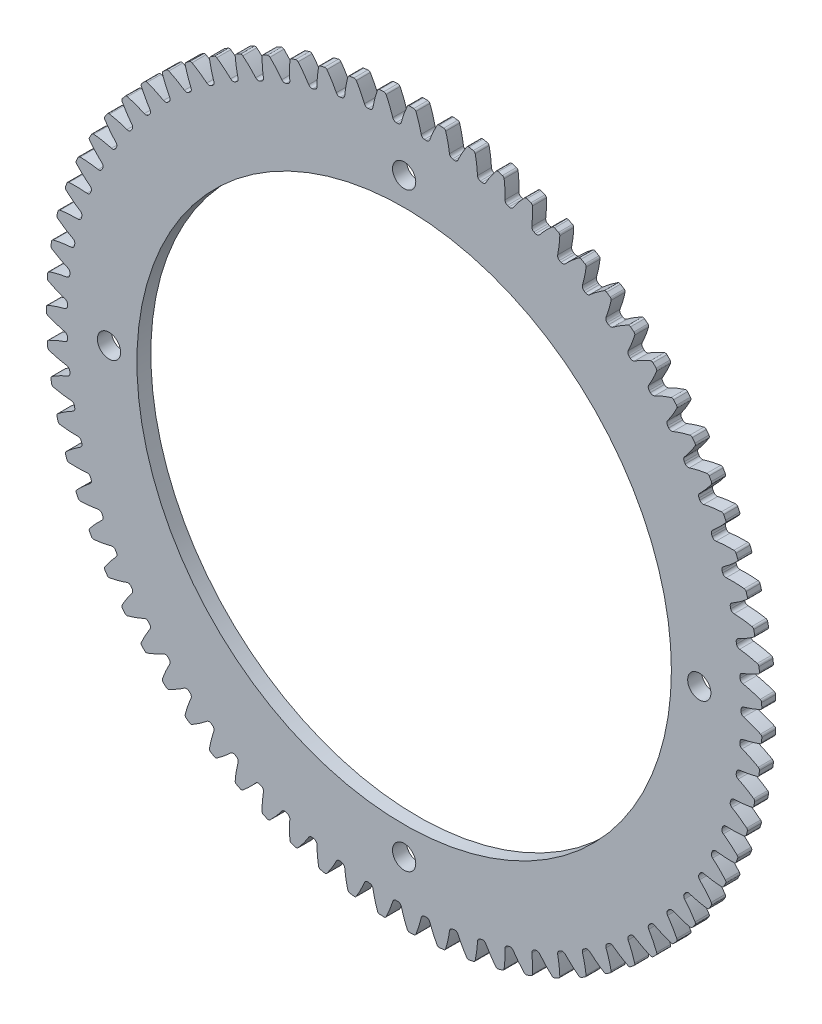
from build123d import *

# Parameters (mm, degrees)
EXTRUDE_1_DEPTH     = 3
SKETCH_2_R          = 57.5
SKETCH_2_R_2        = 2.5
CUT_EXTRUDE_1_DEPTH = 109.929791263


with BuildPart() as part:
    # Model → 凸台-拉伸1 (new body)
    with BuildSketch(Plane.XY):
        with BuildLine():
            ThreePointArc((72.261177751, 5.879812072), (72.253515412, 5.973232849), (72.245732296, 6.066643642))
            ThreePointArc((72.245732296, 6.066643642), (72.237828416, 6.160044293), (72.229803787, 6.253434648))
            ThreePointArc((72.229803787, 6.253434648), (72.342701831, 6.722121547), (72.714839597, 7.028596441))
            add(Edge.make_bspline(
                [(72.714839597, 7.028596441), (73.267882521, 7.240685994), (74.455479939, 7.746382514), (75.600178966, 8.344255475), (76.203885214, 8.693141677)],
                knots=[0, 0, 0, 0, 1.776948533, 3.868752862, 3.868752862, 3.868752862, 3.868752862], degree=3))
            ThreePointArc((76.203885214, 8.693141677), (76.400928601, 8.902464345), (76.450133844, 9.185697323))
            ThreePointArc((76.450133844, 9.185697323), (76.421836535, 9.418221733), (76.392832001, 9.650658984))
            ThreePointArc((76.392832001, 9.650658984), (76.36312051, 9.883006927), (76.332702338, 10.115263409))
            ThreePointArc((76.332702338, 10.115263409), (76.214605791, 10.377361256), (75.971696454, 10.531104969))
            add(Edge.make_bspline(
                [(72.178310054, 11.275665095), (72.766722644, 11.207774908), (74.042771116, 11.013309242), (75.300192277, 10.718894631), (75.971696454, 10.531104969)],
                knots=[0, 0, 0, 0, 1.776948533, 3.868752862, 3.868752862, 3.868752862, 3.868752862], degree=3))
            ThreePointArc((72.178310054, 11.275665095), (71.741646473, 11.479964618), (71.515737637, 11.905850254))
            ThreePointArc((71.515737637, 11.905850254), (71.500284921, 11.998302224), (71.484712688, 12.090734137))
            ThreePointArc((71.484712688, 12.090734137), (71.469020963, 12.18314584), (71.453209774, 12.275537178))
            ThreePointArc((71.453209774, 12.275537178), (71.52649316, 12.75202739), (71.871680628, 13.08856712))
            add(Edge.make_bspline(
                [(71.871680628, 13.08856712), (72.405036756, 13.346190284), (73.546153509, 13.949488846), (74.636809195, 14.641050928), (75.209204116, 15.039230374)],
                knots=[0, 0, 0, 0, 1.776948533, 3.868752862, 3.868752862, 3.868752862, 3.868752862], degree=3))
            ThreePointArc((75.209204116, 15.039230374), (75.388040774, 15.264307084), (75.413373122, 15.550664112))
            ThreePointArc((75.413373122, 15.550664112), (75.365717915, 15.780005168), (75.317365257, 16.009200193))
            ThreePointArc((75.317365257, 16.009200193), (75.268315593, 16.238247065), (75.21856938, 16.467143664))
            ThreePointArc((75.21856938, 16.467143664), (75.078955232, 16.718440232), (74.82403287, 16.851318616))
            add(Edge.make_bspline(
                [(70.981647224, 17.275845072), (71.573677073, 17.257430081), (72.861522731, 17.170423418), (74.139169918, 16.982259652), (74.82403287, 16.851318616)],
                knots=[0, 0, 0, 0, 1.776948533, 3.868752862, 3.868752862, 3.868752862, 3.868752862], degree=3))
            ThreePointArc((70.981647224, 17.275845072), (70.529419741, 17.442889021), (70.268666007, 17.848377451))
            ThreePointArc((70.268666007, 17.848377451), (70.245531304, 17.939212129), (70.222279182, 18.030016819))
            ThreePointArc((70.222279182, 18.030016819), (70.198909679, 18.120791372), (70.175422833, 18.211535634))
            ThreePointArc((70.175422833, 18.211535634), (70.208577531, 18.692486924), (70.524393459, 19.056730904))
            add(Edge.make_bspline(
                [(70.524393459, 19.056730904), (71.034321681, 19.358080639), (72.120953655, 20.054749536), (73.149915834, 20.835149928), (73.686984488, 21.279829676)],
                knots=[0, 0, 0, 0, 1.776948533, 3.868752862, 3.868752862, 3.868752862, 3.868752862], degree=3))
            ThreePointArc((73.686984488, 21.279829676), (73.846360007, 21.519081675), (73.847641773, 21.806554165))
            ThreePointArc((73.847641773, 21.806554165), (73.780962935, 22.031103206), (73.71360131, 22.255448365))
            ThreePointArc((73.71360131, 22.255448365), (73.645557523, 22.479587567), (73.576832202, 22.703518738))
            ThreePointArc((73.576832202, 22.703518738), (73.416679746, 22.942251362), (73.151532456, 23.053332369))
            add(Edge.make_bspline(
                [(69.287099139, 23.154847407), (69.878593583, 23.186036781), (71.169203115, 23.207099411), (72.458114552, 23.126506322), (73.151532456, 23.053332369)],
                knots=[0, 0, 0, 0, 1.776948533, 3.868752862, 3.868752862, 3.868752862, 3.868752862], degree=3))
            ThreePointArc((69.287099139, 23.154847407), (68.822479804, 23.283464089), (68.528710172, 23.665711105))
            ThreePointArc((68.528710172, 23.665711105), (68.498055757, 23.75429135), (68.467286842, 23.842831889))
            ThreePointArc((68.467286842, 23.842831889), (68.43640348, 23.931332572), (68.405405723, 24.019793253))
            ThreePointArc((68.405405723, 24.019793253), (68.398199175, 24.501832093), (68.682428342, 24.891225414))
            add(Edge.make_bspline(
                [(68.682428342, 24.891225414), (69.165351878, 25.234187966), (70.18987713, 26.019340567), (71.149928372, 26.883105322), (71.647903608, 27.371166262)],
                knots=[0, 0, 0, 0, 1.776948533, 3.868752862, 3.868752862, 3.868752862, 3.868752862], degree=3))
            ThreePointArc((71.647903608, 27.371166262), (71.786700084, 27.62291537), (71.763922276, 27.909486909))
            ThreePointArc((71.763922276, 27.909486909), (71.67868751, 28.127668883), (71.592789413, 28.345590557))
            ThreePointArc((71.592789413, 28.345590557), (71.50622878, 28.563249914), (71.419006412, 28.78064494))
            ThreePointArc((71.419006412, 28.78064494), (71.239439001, 29.005139083), (70.965926601, 29.09364356))
            add(Edge.make_bspline(
                [(67.106551836, 28.871435125), (67.693361967, 28.952010093), (68.977682674, 29.080994275), (70.268817573, 29.108537167), (70.965926601, 29.09364356)],
                knots=[0, 0, 0, 0, 1.776948533, 3.868752862, 3.868752862, 3.868752862, 3.868752862], degree=3))
            ThreePointArc((67.106551836, 28.871435125), (66.63279962, 28.960722386), (66.308074674, 29.317046799))
            ThreePointArc((66.308074674, 29.317046799), (66.270115564, 29.402751285), (66.232045679, 29.488406623))
            ThreePointArc((66.232045679, 29.488406623), (66.193865083, 29.574012669), (66.15557384, 29.659569281))
            ThreePointArc((66.15557384, 29.659569281), (66.108056597, 30.139314514), (66.358705338, 30.551125861))
            add(Edge.make_bspline(
                [(66.358705338, 30.551125861), (66.811236827, 30.933295596), (67.766469048, 31.80142462), (68.650875283, 32.742495047), (69.106264163, 33.270513782)],
                knots=[0, 0, 0, 0, 1.776948533, 3.868752862, 3.868752862, 3.868752862, 3.868752862], degree=3))
            ThreePointArc((69.106264163, 33.270513782), (69.223508038, 33.532994161), (69.176830427, 33.816654656))
            ThreePointArc((69.176830427, 33.816654656), (69.073637594, 34.026939173), (68.969805538, 34.236908797))
            ThreePointArc((68.969805538, 34.236908797), (68.86533522, 34.446561585), (68.760227606, 34.655895597))
            ThreePointArc((68.760227606, 34.655895597), (68.562504778, 34.864576594), (68.28254576, 34.929883745))
            add(Edge.make_bspline(
                [(64.455300289, 34.38551047), (65.033310054, 34.514905856), (66.302333349, 34.750906859), (67.586635327, 34.886392538), (68.28254576, 34.929883745)],
                knots=[0, 0, 0, 0, 1.776948533, 3.868752862, 3.868752862, 3.868752862, 3.868752862], degree=3))
            ThreePointArc((64.455300289, 34.38551047), (63.975738223, 34.434842024), (63.622335674, 34.762744473))
            ThreePointArc((63.622335674, 34.762744473), (63.577338126, 34.844972046), (63.532234303, 34.927141372))
            ThreePointArc((63.532234303, 34.927141372), (63.487024283, 35.009252316), (63.44170814, 35.09130474))
            ThreePointArc((63.44170814, 35.09130474), (63.354213499, 35.565391299), (63.569523695, 35.996732112))
            add(Edge.make_bspline(
                [(63.569523695, 35.996732112), (63.988488953, 36.415428382), (64.867727876, 37.360444528), (65.67028563, 38.372219695), (66.079893928, 38.936492553)],
                knots=[0, 0, 0, 0, 1.776948533, 3.868752862, 3.868752862, 3.868752862, 3.868752862], degree=3))
            ThreePointArc((66.079893928, 38.936492553), (66.17476282, 39.207863091), (66.104512816, 39.486622867))
            ThreePointArc((66.104512816, 39.486622867), (65.98408574, 39.687534933), (65.863048032, 39.888079722))
            ThreePointArc((65.863048032, 39.888079722), (65.741400813, 40.088255377), (65.619145207, 40.288060046))
            ThreePointArc((65.619145207, 40.288060046), (65.404653845, 40.47946415), (65.120211922, 40.521115893))
            add(Edge.make_bspline(
                [(61.351941121, 39.658396164), (61.917096197, 39.835704353), (63.161920794, 40.1770668), (64.430381394, 40.419544931), (65.120211922, 40.521115893)],
                knots=[0, 0, 0, 0, 1.776948533, 3.868752862, 3.868752862, 3.868752862, 3.868752862], degree=3))
            ThreePointArc((61.351941121, 39.658396164), (60.869932988, 39.667425986), (60.490331703, 39.964606473))
            ThreePointArc((60.490331703, 39.964606473), (60.43861134, 40.042780363), (60.386789951, 40.12088732))
            ThreePointArc((60.386789951, 40.12088732), (60.334867622, 40.198927212), (60.282844439, 40.276899909))
            ThreePointArc((60.282844439, 40.276899909), (60.155986114, 40.742002417), (60.334447518, 41.18984715))
            add(Edge.make_bspline(
                [(60.334447518, 41.18984715), (60.716907805, 41.642133103), (61.5139862, 42.657407761), (62.229066107, 43.732790792), (62.590020716, 44.329359805)],
                knots=[0, 0, 0, 0, 1.776948533, 3.868752862, 3.868752862, 3.868752862, 3.868752862], degree=3))
            ThreePointArc((62.590020716, 44.329359805), (62.661849187, 44.607717033), (62.568519543, 44.87962079))
            ThreePointArc((62.568519543, 44.87962079), (62.431702934, 45.069751151), (62.294308567, 45.259464427))
            ThreePointArc((62.294308567, 45.259464427), (62.156337714, 45.44875886), (62.017791652, 45.637632701))
            ThreePointArc((62.017791652, 45.637632701), (61.788036259, 45.810417349), (61.501106585, 45.828121527))
            add(Edge.make_bspline(
                [(57.818242167, 44.653106704), (58.366578398, 44.877084006), (59.578472747, 45.321413485), (60.82219463, 45.669183258), (61.501106585, 45.828121527)],
                knots=[0, 0, 0, 0, 1.776948533, 3.868752862, 3.868752862, 3.868752862, 3.868752862], degree=3))
            ThreePointArc((57.818242167, 44.653106704), (57.337168909, 44.621771456), (56.934031516, 44.886145472))
            ThreePointArc((56.934031516, 44.886145472), (56.875951122, 44.959717348), (56.817775656, 45.03321407))
            ThreePointArc((56.817775656, 45.03321407), (56.759505216, 45.106635517), (56.701139898, 45.179981565))
            ThreePointArc((56.701139898, 45.179981565), (56.535807709, 45.632837662), (56.676168542, 46.094045006))
            add(Edge.make_bspline(
                [(56.676168542, 46.094045006), (57.019441173, 46.57674818), (57.728768109, 47.655159928), (58.351354397, 48.786607784), (58.661123479, 49.411288449)],
                knots=[0, 0, 0, 0, 1.776948533, 3.868752862, 3.868752862, 3.868752862, 3.868752862], degree=3))
            ThreePointArc((58.661123479, 49.411288449), (58.709407705, 49.69467989), (58.593653061, 49.957820418))
            ThreePointArc((58.593653061, 49.957820418), (58.441406588, 50.135835447), (58.288619285, 50.313386507))
            ThreePointArc((58.288619285, 50.313386507), (58.135292566, 50.490471956), (57.981427849, 50.667090153))
            ThreePointArc((57.981427849, 50.667090153), (57.738019993, 50.820043386), (57.450615175, 50.813675816))
            add(Edge.make_bspline(
                [(53.878989786, 49.334607784), (54.406660987, 49.603683159), (55.57712452, 50.147863017), (56.787383871, 50.598485078), (57.450615175, 50.813675816)],
                knots=[0, 0, 0, 0, 1.776948533, 3.868752862, 3.868752862, 3.868752862, 3.868752862], degree=3))
            ThreePointArc((53.878989786, 49.334607784), (53.402225786, 49.26312726), (52.978380005, 49.492840412))
            ThreePointArc((52.978380005, 49.492840412), (52.914346972, 49.561294218), (52.850225488, 49.62966518))
            ThreePointArc((52.850225488, 49.62966518), (52.786015662, 49.697953182), (52.721717601, 49.766158112))
            ThreePointArc((52.721717601, 49.766158112), (52.519071233, 50.203591337), (52.620346965, 50.674926254))
            add(Edge.make_bspline(
                [(52.620346965, 50.674926254), (52.922024131, 51.184660834), (53.538624187, 52.318645388), (54.064349862, 53.498221775), (54.320760609, 54.146632406)],
                knots=[0, 0, 0, 0, 1.776948533, 3.868752862, 3.868752862, 3.868752862, 3.868752862], degree=3))
            ThreePointArc((54.320760609, 54.146632406), (54.345161911, 54.433070273), (54.207794202, 54.685601832))
            ThreePointArc((54.207794202, 54.685601832), (54.041185766, 54.85025288), (53.87407722, 55.014396332))
            ThreePointArc((53.87407722, 55.014396332), (53.70647011, 55.178030667), (53.538365988, 55.341154373))
            ThreePointArc((53.538365988, 55.341154373), (53.283013002, 55.473203332), (52.997148977, 55.442808679))
            add(Edge.make_bspline(
                [(49.561815005, 53.670062036), (50.065119942, 53.982348115), (51.185942697, 54.622561321), (52.354250415, 55.17287488), (52.997148977, 55.442808679)],
                knots=[0, 0, 0, 0, 1.776948533, 3.868752862, 3.868752862, 3.868752862, 3.868752862], degree=3))
            ThreePointArc((49.561815005, 53.670062036), (49.092704419, 53.558937622), (48.651123224, 53.752378636))
            ThreePointArc((48.651123224, 53.752378636), (48.581586696, 53.815234219), (48.511968961, 53.877999847))
            ThreePointArc((48.511968961, 53.877999847), (48.442270135, 53.940675414), (48.372490335, 54.003260816))
            ThreePointArc((48.372490335, 54.003260816), (48.133951207, 54.422202891), (48.195431462, 54.900359305))
            add(Edge.make_bspline(
                [(48.195431462, 54.900359305), (48.453397113, 55.433549868), (48.972945284, 56.615153142), (49.398122757, 57.834584179), (49.599376632, 58.50217664)],
                knots=[0, 0, 0, 0, 1.776948533, 3.868752862, 3.868752862, 3.868752862, 3.868752862], degree=3))
            ThreePointArc((49.599376632, 58.50217664), (49.599723852, 58.789651778), (49.441706616, 59.02980304))
            ThreePointArc((49.441706616, 59.02980304), (49.261904854, 59.179935199), (49.081647211, 59.329519694))
            ThreePointArc((49.081647211, 59.329519694), (48.900935355, 59.478555139), (48.719770958, 59.627040156))
            ThreePointArc((48.719770958, 59.627040156), (48.454263958, 59.737258614), (48.171945858, 59.683050075))
            add(Edge.make_bspline(
                [(44.896999701, 57.629059366), (45.372408051, 57.982365685), (46.435728263, 58.714121605), (47.55388951, 59.360266606), (48.171945858, 59.683050075)],
                knots=[0, 0, 0, 0, 1.776948533, 3.868752862, 3.868752862, 3.868752862, 3.868752862], degree=3))
            ThreePointArc((44.896999701, 57.629059366), (44.438833003, 57.479070519), (43.982613769, 57.634882546))
            ThreePointArc((43.982613769, 57.634882546), (43.908061496, 57.691699019), (43.833435828, 57.748419057))
            ThreePointArc((43.833435828, 57.748419057), (43.758736889, 57.805042564), (43.683964805, 57.861569447))
            ThreePointArc((43.683964805, 57.861569447), (43.411206098, 58.259081794), (43.432459635, 58.74070578))
            add(Edge.make_bspline(
                [(43.432459635, 58.74070578), (43.644904328, 59.293612379), (44.063756357, 60.514546274), (44.385403314, 61.765278529), (44.530088666, 62.44737014)],
                knots=[0, 0, 0, 0, 1.776948533, 3.868752862, 3.868752862, 3.868752862, 3.868752862], degree=3))
            ThreePointArc((44.530088666, 62.44737014), (44.506379369, 62.733866117), (44.328820981, 62.959952592))
            ThreePointArc((44.328820981, 62.959952592), (44.137087074, 63.094512793), (43.944944712, 63.228489103))
            ThreePointArc((43.944944712, 63.228489103), (43.752395673, 63.361880282), (43.559441739, 63.494685095))
            ThreePointArc((43.559441739, 63.494685095), (43.285643067, 63.582299948), (43.00885115, 63.504657756))
            add(Edge.make_bspline(
                [(39.917264203, 61.183830251), (40.361441318, 61.57567862), (41.359800559, 62.393844511), (42.419972237, 63.131288712), (43.00885115, 63.504657756)],
                knots=[0, 0, 0, 0, 1.776948533, 3.868752862, 3.868752862, 3.868752862, 3.868752862], degree=3))
            ThreePointArc((39.917264203, 61.183830251), (39.473255103, 60.996029034), (39.00559788, 61.113119165))
            ThreePointArc((39.00559788, 61.113119165), (38.926552792, 61.163498001), (38.847442636, 61.213774599))
            ThreePointArc((38.847442636, 61.213774599), (38.768267544, 61.263948874), (38.689027649, 61.314020742))
            ThreePointArc((38.689027649, 61.314020742), (38.383962569, 61.687315097), (38.364840311, 62.16902841))
            add(Edge.make_bspline(
                [(38.364840311, 62.16902841), (38.530273898, 62.737772801), (38.845491839, 63.989473344), (39.061352157, 65.262733828), (39.148454122, 65.954540206)],
                knots=[0, 0, 0, 0, 1.776948533, 3.868752862, 3.868752862, 3.868752862, 3.868752862], degree=3))
            ThreePointArc((39.148454122, 65.954540206), (39.100854611, 66.238047459), (38.905000517, 66.448483314))
            ThreePointArc((38.905000517, 66.448483314), (38.70267934, 66.566527714), (38.5, 66.683956091))
            ThreePointArc((38.5, 66.683956091), (38.296964372, 66.80076736), (38.093574334, 66.916960439))
            ThreePointArc((38.093574334, 66.916960439), (37.81340449, 66.981357132), (37.544080253, 66.880825892))
            add(Edge.make_bspline(
                [(34.657537777, 64.309440526), (35.067368074, 64.737082411), (35.993763571, 65.635919427), (36.988509337, 66.459490188), (37.544080253, 66.880825892)],
                knots=[0, 0, 0, 0, 1.776948533, 3.868752862, 3.868752862, 3.868752862, 3.868752862], degree=3))
            ThreePointArc((34.657537777, 64.309440526), (34.23080068, 64.085144231), (33.754985747, 64.162691163))
            ThreePointArc((33.754985747, 64.162691163), (33.672002289, 64.206278991), (33.588962546, 64.249759494))
            ThreePointArc((33.588962546, 64.249759494), (33.505866657, 64.2931326), (33.422714761, 64.336398236))
            ThreePointArc((33.422714761, 64.336398236), (33.087483122, 64.682856206), (33.028119196, 65.161279974))
            add(Edge.make_bspline(
                [(33.028119196, 65.161279974), (33.145381281, 65.741872825), (33.354754107, 67.015560235), (33.46331368, 68.302417941), (33.492221301, 68.999086561)],
                knots=[0, 0, 0, 0, 1.776948533, 3.868752862, 3.868752862, 3.868752862, 3.868752862], degree=3))
            ThreePointArc((33.492221301, 68.999086561), (33.421065453, 69.277616489), (33.208289428, 69.470925669))
            ThreePointArc((33.208289428, 69.470925669), (32.996800119, 69.57162627), (32.785005451, 69.67168304))
            ThreePointArc((32.785005451, 69.67168304), (32.572907382, 69.771095052), (32.360507875, 69.869861386))
            ThreePointArc((32.360507875, 69.869861386), (32.07593205, 69.910588222), (31.815964608, 69.787873087))
            add(Edge.make_bspline(
                [(29.154713624, 66.983966283), (29.527322438, 67.444402083), (30.375256193, 68.417605529), (31.297598621, 69.321526091), (31.815964608, 69.787873087)],
                knots=[0, 0, 0, 0, 1.776948533, 3.868752862, 3.868752862, 3.868752862, 3.868752862], degree=3))
            ThreePointArc((29.154713624, 66.983966283), (28.748241785, 66.724748187), (28.267606642, 66.762207983))
            ThreePointArc((28.267606642, 66.762207983), (28.181266883, 66.798699066), (28.094880018, 66.83507849))
            ThreePointArc((28.094880018, 66.83507849), (28.00844619, 66.871346196), (27.921965544, 66.907502122))
            ThreePointArc((27.921965544, 66.907502122), (27.558918754, 67.224693554), (27.459729557, 67.696471978))
            add(Edge.make_bspline(
                [(27.459729557, 67.696471978), (27.527997629, 68.284840845), (27.630056739, 69.571581121), (27.630554101, 70.863009667), (27.601064611, 71.5596539)],
                knots=[0, 0, 0, 0, 1.776948533, 3.868752862, 3.868752862, 3.868752862, 3.868752862], degree=3))
            ThreePointArc((27.601064611, 71.5596539), (27.506851533, 71.831252816), (27.278646049, 72.006079394))
            ThreePointArc((27.278646049, 72.006079394), (27.059472054, 72.088729855), (26.840047644, 72.170713191))
            ThreePointArc((26.840047644, 72.170713191), (26.62037485, 72.252028642), (26.400455705, 72.332675456))
            ThreePointArc((26.400455705, 72.332675456), (26.113469993, 72.349446766), (25.864682831, 72.205408495))
            add(Edge.make_bspline(
                [(23.447390104, 69.188647645), (23.780163851, 69.678647733), (24.543688218, 70.719391285), (25.387157738, 71.697321296), (25.864682831, 72.205408495)],
                knots=[0, 0, 0, 0, 1.776948533, 3.868752862, 3.868752862, 3.868752862, 3.868752862], degree=3))
            ThreePointArc((23.447390104, 69.188647645), (23.06403463, 68.896325976), (22.581950587, 68.893435883))
            ThreePointArc((22.581950587, 68.893435883), (22.492860138, 68.922574261), (22.403732092, 68.951597431))
            ThreePointArc((22.403732092, 68.951597431), (22.314566597, 68.980505345), (22.225363801, 69.009297953))
            ThreePointArc((22.225363801, 69.009297953), (21.837048371, 69.294997978), (21.698729644, 69.75682187))
            add(Edge.make_bspline(
                [(21.698729644, 69.75682187), (21.717524853, 70.34883977), (21.711554376, 71.639607353), (21.603986038, 72.926548296), (21.516306285, 73.618281682)],
                knots=[0, 0, 0, 0, 1.776948533, 3.868752862, 3.868752862, 3.868752862, 3.868752862], degree=3))
            ThreePointArc((21.516306285, 73.618281682), (21.399696814, 73.881044516), (21.157662567, 74.036162209))
            ThreePointArc((21.157662567, 74.036162209), (20.932341234, 74.100182797), (20.706826187, 74.163517643))
            ThreePointArc((20.706826187, 74.163517643), (20.481119515, 74.226166164), (20.255223306, 74.288127778))
            ThreePointArc((20.255223306, 74.288127778), (19.967840707, 74.280825924), (19.731978888, 74.116474843))
            add(Edge.make_bspline(
                [(17.575599988, 70.908020355), (17.866204501, 71.424147734), (18.539963904, 72.525131324), (19.298644184, 73.570211307), (19.731978888, 74.116474843)],
                knots=[0, 0, 0, 0, 1.776948533, 3.868752862, 3.868752862, 3.868752862, 3.868752862], degree=3))
            ThreePointArc((17.575599988, 70.908020355), (17.218049843, 70.58464554), (16.737898373, 70.541425829))
            ThreePointArc((16.737898373, 70.541425829), (16.646682141, 70.563007119), (16.555438083, 70.584470458))
            ThreePointArc((16.555438083, 70.584470458), (16.464166352, 70.605815811), (16.372867099, 70.627043142))
            ThreePointArc((16.372867099, 70.627043142), (15.962006784, 70.879247779), (15.785528733, 71.327877777))
            add(Edge.make_bspline(
                [(15.785528733, 71.327877777), (15.754719243, 71.91939213), (15.640761058, 73.205133212), (15.425881535, 74.478559586), (15.280626529, 75.160530113)],
                knots=[0, 0, 0, 0, 1.776948533, 3.868752862, 3.868752862, 3.868752862, 3.868752862], degree=3))
            ThreePointArc((15.280626529, 75.160530113), (15.142438597, 75.412613771), (14.888273284, 75.546934541))
            ThreePointArc((14.888273284, 75.546934541), (14.65838508, 75.591876196), (14.428361223, 75.636118306))
            ThreePointArc((14.428361223, 75.636118306), (14.198203843, 75.679660462), (13.96791507, 75.722502261))
            ThreePointArc((13.96791507, 75.722502261), (13.682151365, 75.691178459), (13.460869291, 75.507667372))
            add(Edge.make_bspline(
                [(11.580529667, 72.130024249), (11.826926563, 72.668658656), (12.406195065, 73.822159675), (13.074764507, 74.927059145), (13.460869291, 75.507667372)],
                knots=[0, 0, 0, 0, 1.776948533, 3.868752862, 3.868752862, 3.868752862, 3.868752862], degree=3))
            ThreePointArc((11.580529667, 72.130024249), (11.251292808, 71.77786453), (10.776441829, 71.694618358))
            ThreePointArc((10.776441829, 71.694618358), (10.683739629, 71.708491182), (10.591019571, 71.72224414))
            ThreePointArc((10.591019571, 71.72224414), (10.498281809, 71.73587721), (10.405526499, 71.749390369))
            ThreePointArc((10.405526499, 71.749390369), (9.975003189, 71.966330584), (9.76160368, 72.39861987))
            add(Edge.make_bspline(
                [(9.76160368, 72.39861987), (9.681405598, 72.985481628), (9.46025904, 74.25717766), (9.139575557, 75.508157293), (8.937764158, 76.175581428)],
                knots=[0, 0, 0, 0, 1.776948533, 3.868752862, 3.868752862, 3.868752862, 3.868752862], degree=3))
            ThreePointArc((8.937764158, 76.175581428), (8.778967053, 76.415217725), (8.514453462, 76.527799408))
            ThreePointArc((8.514453462, 76.527799408), (8.281610887, 76.553346897), (8.048691672, 76.578185943))
            ThreePointArc((8.048691672, 76.578185943), (7.815697972, 76.602316318), (7.582631945, 76.625737796))
            ThreePointArc((7.582631945, 76.625737796), (7.300491562, 76.570611761), (7.095341367, 76.369227866))
            add(Edge.make_bspline(
                [(5.504230251, 72.846087849), (5.704691233, 73.40345115), (6.185405681, 74.601378618), (6.759174751, 75.758347499), (7.095341367, 76.369227866)],
                knots=[0, 0, 0, 0, 1.776948533, 3.868752862, 3.868752862, 3.868752862, 3.868752862], degree=3))
            ThreePointArc((5.504230251, 72.846087849), (5.205616037, 72.467613373), (4.739396288, 72.344924651))
            ThreePointArc((4.739396288, 72.344924651), (4.64585836, 72.350991701), (4.552312666, 72.356937811))
            ThreePointArc((4.552312666, 72.356937811), (4.458759363, 72.362762972), (4.365198606, 72.368467174))
            ThreePointArc((4.365198606, 72.368467174), (3.918032113, 72.548621288), (3.669207991, 72.961537664))
            add(Edge.make_bspline(
                [(3.669207991, 72.961537664), (3.540183849, 73.539630412), (3.213400101, 74.78836136), (2.789162023, 76.008119529), (2.532209792, 76.656315771)],
                knots=[0, 0, 0, 0, 1.776948533, 3.868752862, 3.868752862, 3.868752862, 3.868752862], degree=3))
            ThreePointArc((2.532209792, 76.656315771), (2.353917363, 76.881823831), (2.080910865, 76.971876747))
            ThreePointArc((2.080910865, 76.971876747), (1.846747143, 76.977850873), (1.612566331, 76.983112628))
            ThreePointArc((1.612566331, 76.983112628), (1.378370596, 76.987661963), (1.144162105, 76.991498836))
            ThreePointArc((1.144162105, 76.991498836), (0.867624055, 76.912957237), (0.680044721, 76.695113098))
            add(Edge.make_bspline(
                [(-0.610677386, 73.051188482), (-0.457558408, 73.623371174), (-0.07876988, 74.85732249), (0.39617424, 76.058245477), (0.680044721, 76.695113098)],
                knots=[0, 0, 0, 0, 1.776948533, 3.868752862, 3.868752862, 3.868752862, 3.868752862], degree=3))
            ThreePointArc((-0.610677386, 73.051188482), (-0.876574389, 72.649053977), (-1.330892713, 72.487783278))
            ThreePointArc((-1.330892713, 72.487783278), (-1.424610268, 72.486001998), (-1.518325442, 72.484099552))
            ThreePointArc((-1.518325442, 72.484099552), (-1.612038077, 72.482075945), (-1.705748018, 72.479931179))
            ThreePointArc((-1.705748018, 72.479931179), (-2.166421143, 72.622035539), (-2.448924556, 73.012682693))
            add(Edge.make_bspline(
                [(-2.448924556, 73.012682693), (-2.625869746, 73.577951527), (-3.05599853, 74.79495844), (-3.580815479, 75.974939418), (-3.891106205, 76.599361136)],
                knots=[0, 0, 0, 0, 1.776948533, 3.868752862, 3.868752862, 3.868752862, 3.868752862], degree=3))
            ThreePointArc((-3.891106205, 76.599361136), (-4.087643366, 76.809159181), (-4.367227825, 76.876051675))
            ThreePointArc((-4.367227825, 76.876051675), (-4.601070204, 76.862410533), (-4.834870004, 76.848058089))
            ThreePointArc((-4.834870004, 76.848058089), (-5.06862506, 76.832994475), (-5.302333211, 76.817219831))
            ThreePointArc((-5.302333211, 76.817219831), (-5.57132921, 76.71581358), (-5.740021949, 76.483037217))
            add(Edge.make_bspline(
                [(-6.721301559, 72.743887516), (-6.616598605, 73.326876148), (-6.342392927, 74.58819603), (-5.969605148, 75.824649511), (-5.740021949, 76.483037217)],
                knots=[0, 0, 0, 0, 1.776948533, 3.868752862, 3.868752862, 3.868752862, 3.868752862], degree=3))
            ThreePointArc((-6.721301559, 72.743887516), (-6.952616277, 72.320913664), (-7.391846458, 72.122192188))
            ThreePointArc((-7.391846458, 72.122192188), (-7.485086278, 72.112575071), (-7.578313587, 72.102837414))
            ThreePointArc((-7.578313587, 72.102837414), (-7.671528228, 72.092979233), (-7.764730046, 72.083000543))
            ThreePointArc((-7.764730046, 72.083000543), (-8.235678512, 72.186058389), (-8.549879656, 72.551696213))
            add(Edge.make_bspline(
                [(-8.549879656, 72.551696213), (-8.773504752, 73.100176177), (-9.303961528, 74.276922627), (-9.925676133, 75.408849695), (-10.287128889, 76.00511702)],
                knots=[0, 0, 0, 0, 1.776948533, 3.868752862, 3.868752862, 3.868752862, 3.868752862], degree=3))
            ThreePointArc((-10.287128889, 76.00511702), (-10.500532214, 76.197733468), (-10.784733551, 76.240996336))
            ThreePointArc((-10.784733551, 76.240996336), (-11.01661435, 76.207835609), (-11.248393199, 76.173969638))
            ThreePointArc((-11.248393199, 76.173969638), (-11.480067953, 76.139398735), (-11.711636468, 76.104123221))
            ThreePointArc((-11.711636468, 76.104123221), (-11.971203604, 75.980563611), (-12.11982649, 75.734487783))
            add(Edge.make_bspline(
                [(-12.784780631, 71.926340445), (-12.729228117, 72.516045771), (-12.561528644, 73.795886967), (-12.293512045, 75.059198108), (-12.11982649, 75.734487783)],
                knots=[0, 0, 0, 0, 1.776948533, 3.868752862, 3.868752862, 3.868752862, 3.868752862], degree=3))
            ThreePointArc((-12.784780631, 71.926340445), (-12.979890556, 71.485494106), (-13.40095171, 71.250715739))
            ThreePointArc((-13.40095171, 71.250715739), (-13.493059786, 71.233330244), (-13.585145307, 71.215825678))
            ThreePointArc((-13.585145307, 71.215825678), (-13.67720812, 71.19820207), (-13.769248071, 71.18045945))
            ThreePointArc((-13.769248071, 71.18045945), (-14.247168513, 71.243747906), (-14.590863494, 71.581811713))
            add(Edge.make_bspline(
                [(-14.590863494, 71.581811713), (-14.859599926, 72.109655614), (-15.48666392, 73.23788757), (-16.2009153, 74.313821073), (-16.610994754, 74.877751617)],
                knots=[0, 0, 0, 0, 1.776948533, 3.868752862, 3.868752862, 3.868752862, 3.868752862], degree=3))
            ThreePointArc((-16.610994754, 74.877751617), (-16.839767373, 75.051835402), (-17.126592119, 75.071165186))
            ThreePointArc((-17.126592119, 75.071165186), (-17.354884862, 75.018717474), (-17.583016999, 74.965575521))
            ThreePointArc((-17.583016999, 74.965575521), (-17.810986418, 74.91173982), (-18.03879101, 74.857210868))
            ThreePointArc((-18.03879101, 74.857210868), (-18.287108607, 74.712364581), (-18.414619157, 74.454715333))
            add(Edge.make_bspline(
                [(-18.758583653, 70.604281774), (-18.752571239, 71.196567436), (-18.692554263, 72.485952778), (-18.531188788, 73.767260361), (-18.414619157, 74.454715333)],
                knots=[0, 0, 0, 0, 1.776948533, 3.868752862, 3.868752862, 3.868752862, 3.868752862], degree=3))
            ThreePointArc((-18.758583653, 70.604281774), (-18.916120229, 70.148655168), (-19.316058916, 69.879466712))
            ThreePointArc((-19.316058916, 69.879466712), (-19.406389175, 69.854434786), (-19.496686995, 69.829286093))
            ThreePointArc((-19.496686995, 69.829286093), (-19.586952225, 69.804020676), (-19.677184714, 69.778638578))
            ThreePointArc((-19.677184714, 69.778638578), (-20.158724863, 69.80171372), (-20.529502908, 70.109832234))
            add(Edge.make_bspline(
                [(-20.529502908, 70.109832234), (-20.841465682, 70.613337628), (-21.560738492, 71.685141353), (-22.362516687, 72.697534391), (-22.818346426, 73.225172586)],
                knots=[0, 0, 0, 0, 1.776948533, 3.868752862, 3.868752862, 3.868752862, 3.868752862], degree=3))
            ThreePointArc((-22.818346426, 73.225172586), (-23.060883663, 73.379502636), (-23.348319949, 73.374763751))
            ThreePointArc((-23.348319949, 73.374763751), (-23.571423326, 73.303396936), (-23.794308567, 73.231351755))
            ThreePointArc((-23.794308567, 73.231351755), (-24.01697361, 73.158628873), (-24.239416394, 73.085228965))
            ThreePointArc((-24.239416394, 73.085228965), (-24.474742681, 72.920111994), (-24.5802465, 72.65269655))
            add(Edge.make_bspline(
                [(-24.600808689, 68.786984797), (-24.644378548, 69.377696335), (-24.692465045, 70.667581712), (-24.638882556, 71.957898284), (-24.5802465, 72.65269655)],
                knots=[0, 0, 0, 0, 1.776948533, 3.868752862, 3.868752862, 3.868752862, 3.868752862], degree=3))
            ThreePointArc((-24.600808689, 68.786984797), (-24.71966691, 68.319773816), (-25.095677846, 68.018063435))
            ThreePointArc((-25.095677846, 68.018063435), (-25.183596686, 67.985560658), (-25.271473431, 67.952944238))
            ThreePointArc((-25.271473431, 67.952944238), (-25.359307932, 67.920214231), (-25.447100044, 67.887370691))
            ThreePointArc((-25.447100044, 67.887370691), (-25.928882243, 67.870070664), (-26.32414261, 68.146082657))
            add(Edge.make_bspline(
                [(-26.32414261, 68.146082657), (-26.677143532, 68.621717814), (-27.483579974, 69.629575375), (-28.367261087, 70.571326737), (-28.865643794, 71.058971582)],
                knots=[0, 0, 0, 0, 1.776948533, 3.868752862, 3.868752862, 3.868752862, 3.868752862], degree=3))
            ThreePointArc((-28.865643794, 71.058971582), (-29.120244424, 71.192465382), (-29.40627609, 71.163691068))
            ThreePointArc((-29.40627609, 71.163691068), (-29.622625191, 71.073905738), (-29.838700157, 70.983462672))
            ThreePointArc((-29.838700157, 70.983462672), (-30.054498988, 70.89236271), (-30.270019689, 70.800606693))
            ThreePointArc((-30.270019689, 70.800606693), (-30.490704021, 70.616377214), (-30.573461076, 70.341071301))
            add(Edge.make_bspline(
                [(-30.270476728, 66.487196544), (-30.363323248, 67.072190542), (-30.519175925, 68.353528335), (-30.573752266, 69.643803252), (-30.573461076, 70.341071301)],
                knots=[0, 0, 0, 0, 1.776948533, 3.868752862, 3.868752862, 3.868752862, 3.868752862], degree=3))
            ThreePointArc((-30.270476728, 66.487196544), (-30.349822889, 66.011678338), (-30.699268627, 65.679562314))
            ThreePointArc((-30.699268627, 65.679562314), (-30.784159362, 65.639816669), (-30.868998638, 65.599961304))
            ThreePointArc((-30.868998638, 65.599961304), (-30.953786316, 65.559996284), (-31.038522252, 65.519921676))
            ThreePointArc((-31.038522252, 65.519921676), (-31.517167143, 65.462367828), (-31.934137365, 65.704337272))
            add(Edge.make_bspline(
                [(-31.934137365, 65.704337272), (-32.325700387, 66.148765954), (-33.213643891, 67.085607954), (-34.173029532, 67.950111933), (-34.710469409, 68.394342948)],
                knots=[0, 0, 0, 0, 1.776948533, 3.868752862, 3.868752862, 3.868752862, 3.868752862], degree=3))
            ThreePointArc((-34.710469409, 68.394342948), (-34.975347593, 68.506064135), (-35.257968333, 68.453456224))
            ThreePointArc((-35.257968333, 68.453456224), (-35.466045624, 68.345882157), (-35.673794704, 68.237675601))
            ThreePointArc((-35.673794704, 68.237675601), (-35.881213651, 68.128837558), (-36.088300544, 68.019369035))
            ThreePointArc((-36.088300544, 68.019369035), (-36.29279498, 67.817319285), (-36.352224789, 67.536053978))
            add(Edge.make_bspline(
                [(-35.727819121, 63.721048378), (-35.869291052, 64.296221523), (-36.131816715, 65.560024069), (-36.294169071, 66.84120698), (-36.352224789, 67.536053978)],
                knots=[0, 0, 0, 0, 1.776948533, 3.868752862, 3.868752862, 3.868752862, 3.868752862], degree=3))
            ThreePointArc((-35.727819121, 63.721048378), (-35.767096666, 63.240558366), (-36.087526097, 62.880366254))
            ThreePointArc((-36.087526097, 62.880366254), (-36.168793278, 62.833656529), (-36.25, 62.786841774))
            ThreePointArc((-36.25, 62.786841774), (-36.331146128, 62.739922067), (-36.412231527, 62.692897486))
            ThreePointArc((-36.412231527, 62.692897486), (-36.884381761, 62.595493516), (-37.320137091, 62.80172317))
            add(Edge.make_bspline(
                [(-37.320137091, 62.80172317), (-37.74751568, 63.211828029), (-38.710737959, 64.071083195), (-39.739098729, 64.852275915), (-40.311826022, 65.24997714)],
                knots=[0, 0, 0, 0, 1.776948533, 3.868752862, 3.868752862, 3.868752862, 3.868752862], degree=3))
            ThreePointArc((-40.311826022, 65.24997714), (-40.585123828, 65.339142069), (-40.862351261, 65.263069568))
            ThreePointArc((-40.862351261, 65.263069568), (-41.06069723, 65.138461319), (-41.258663213, 65.013250264))
            ThreePointArc((-41.258663213, 65.013250264), (-41.45624738, 64.887437561), (-41.6534479, 64.761024375))
            ThreePointArc((-41.6534479, 64.761024375), (-41.840318058, 64.542571589), (-41.876003764, 64.25731976))
            add(Edge.make_bspline(
                [(-40.934556534, 60.507942842), (-41.123661551, 61.069260708), (-41.491018771, 62.306663339), (-41.760008358, 63.569767666), (-41.876003764, 64.25731976)],
                knots=[0, 0, 0, 0, 1.776948533, 3.868752862, 3.868752862, 3.868752862, 3.868752862], degree=3))
            ThreePointArc((-40.934556534, 60.507942842), (-40.933489959, 60.025851315), (-41.222655499, 59.640109604))
            ThreePointArc((-41.222655499, 59.640109604), (-41.299729096, 59.586763435), (-41.376733657, 59.533317662))
            ThreePointArc((-41.376733657, 59.533317662), (-41.453669055, 59.479772376), (-41.53053516, 59.426127666))
            ThreePointArc((-41.53053516, 59.426127666), (-41.992878943, 59.289556791), (-42.444362869, 59.458600103))
            add(Edge.make_bspline(
                [(-42.444362869, 59.458600103), (-42.904559272, 59.831504547), (-43.936304014, 60.607145822), (-45.0264267, 61.299547777), (-45.630424138, 61.647929624)],
                knots=[0, 0, 0, 0, 1.776948533, 3.868752862, 3.868752862, 3.868752862, 3.868752862], degree=3))
            ThreePointArc((-45.630424138, 61.647929624), (-45.91022458, 61.713912868), (-46.180114155, 61.61490937))
            ThreePointArc((-46.180114155, 61.61490937), (-46.367337547, 61.474140977), (-46.554131844, 61.332803688))
            ThreePointArc((-46.554131844, 61.332803688), (-46.740495319, 61.190898811), (-46.926426247, 61.048427659))
            ThreePointArc((-46.926426247, 61.048427659), (-47.094361367, 60.815104126), (-47.10605266, 60.527866613))
            add(Edge.make_bspline(
                [(-45.854167444, 56.870417561), (-46.089579112, 57.413942906), (-46.559191142, 58.616266132), (-46.93293119, 59.852432106), (-47.10605266, 60.527866613)],
                knots=[0, 0, 0, 0, 1.776948533, 3.868752862, 3.868752862, 3.868752862, 3.868752862], degree=3))
            ThreePointArc((-45.854167444, 56.870417561), (-45.812764231, 56.390106046), (-46.068637592, 55.981520437))
            ThreePointArc((-46.068637592, 55.981520437), (-46.140976988, 55.921912007), (-46.213239257, 55.862210101))
            ThreePointArc((-46.213239257, 55.862210101), (-46.285424277, 55.802414818), (-46.357531928, 55.742526257))
            ThreePointArc((-46.357531928, 55.742526257), (-46.80682625, 55.567746425), (-47.270871939, 55.698417677))
            add(Edge.make_bspline(
                [(-47.270871939, 55.698417677), (-47.760658208, 56.031506051), (-48.853688465, 56.718092867), (-49.997926639, 57.316847356), (-50.628957615, 57.613466175)],
                knots=[0, 0, 0, 0, 1.776948533, 3.868752862, 3.868752862, 3.868752862, 3.868752862], degree=3))
            ThreePointArc((-50.628957615, 57.613466175), (-50.913298093, 57.65580491), (-51.173956728, 57.534564853))
            ThreePointArc((-51.173956728, 57.534564853), (-51.348744305, 57.378623705), (-51.52305669, 57.222151562))
            ThreePointArc((-51.52305669, 57.222151562), (-51.696892268, 57.065149872), (-51.870249431, 56.907620087))
            ThreePointArc((-51.870249431, 56.907620087), (-52.018071568, 56.661062404), (-52.005686443, 56.373853971))
            add(Edge.make_bspline(
                [(-50.452144316, 52.833987163), (-50.732211391, 53.355907547), (-51.30078424, 54.514717935), (-51.776653231, 55.715274739), (-52.005686443, 56.373853971)],
                knots=[0, 0, 0, 0, 1.776948533, 3.868752862, 3.868752862, 3.868752862, 3.868752862], degree=3))
            ThreePointArc((-50.452144316, 52.833987163), (-50.370694878, 52.358824699), (-50.591481293, 51.930261126))
            ThreePointArc((-50.591481293, 51.930261126), (-50.658579079, 51.864808547), (-50.725592187, 51.799269273))
            ThreePointArc((-50.725592187, 51.799269273), (-50.792520504, 51.733643414), (-50.859363918, 51.667931078))
            ThreePointArc((-50.859363918, 51.667931078), (-51.292457302, 51.456168243), (-51.765809806, 51.54755087))
            add(Edge.make_bspline(
                [(-51.765809806, 51.54755087), (-52.281750442, 51.838486797), (-53.428399392, 52.431203243), (-54.618727046, 52.932110433), (-55.272365331, 53.174885657)],
                knots=[0, 0, 0, 0, 1.776948533, 3.868752862, 3.868752862, 3.868752862, 3.868752862], degree=3))
            ThreePointArc((-55.272365331, 53.174885657), (-55.559251401, 53.193282906), (-55.808850763, 53.050656702))
            ThreePointArc((-55.808850763, 53.050656702), (-55.969976517, 52.880636614), (-56.130584311, 52.710127157))
            ThreePointArc((-56.130584311, 52.710127157), (-56.290672661, 52.539129907), (-56.450240083, 52.367646448))
            ThreePointArc((-56.450240083, 52.367646448), (-56.576912373, 52.10958404), (-56.540537702, 51.824419248))
            add(Edge.make_bspline(
                [(-54.696235645, 48.426964305), (-55.018993657, 48.923618833), (-55.682539195, 50.030788159), (-56.257199252, 51.187314751), (-56.540537702, 51.824419248)],
                knots=[0, 0, 0, 0, 1.776948533, 3.868752862, 3.868752862, 3.868752862, 3.868752862], degree=3))
            ThreePointArc((-54.696235645, 48.426964305), (-54.575311291, 47.960283817), (-54.759462102, 47.514748345))
            ThreePointArc((-54.759462102, 47.514748345), (-54.820847636, 47.44391072), (-54.882141535, 47.372993789))
            ThreePointArc((-54.882141535, 47.372993789), (-54.943343694, 47.301997671), (-55.004454012, 47.230922485))
            ThreePointArc((-55.004454012, 47.230922485), (-55.418308619, 46.983662013), (-55.897647711, 47.035115031))
            add(Edge.make_bspline(
                [(-55.897647711, 47.035115031), (-56.436123762, 47.281857805), (-57.628348486, 47.776546399), (-58.856416327, 48.176092787), (-59.528077118, 48.363321522)],
                knots=[0, 0, 0, 0, 1.776948533, 3.868752862, 3.868752862, 3.868752862, 3.868752862], degree=3))
            ThreePointArc((-59.528077118, 48.363321522), (-59.815496479, 48.357648241), (-60.052285808, 48.194636312))
            ThreePointArc((-60.052285808, 48.194636312), (-60.198619557, 48.011729852), (-60.344396214, 47.828379081))
            ThreePointArc((-60.344396214, 47.828379081), (-60.48961443, 47.644585696), (-60.634272861, 47.460351396))
            ThreePointArc((-60.634272861, 47.460351396), (-60.738906787, 47.192594385), (-60.678797712, 46.911473459))
            add(Edge.make_bspline(
                [(-58.55667218, 43.680261088), (-58.919857215, 44.148166084), (-59.673721146, 45.195928352), (-60.34314144, 46.300312529), (-60.678797712, 46.911473459)],
                knots=[0, 0, 0, 0, 1.776948533, 3.868752862, 3.868752862, 3.868752862, 3.868752862], degree=3))
            ThreePointArc((-58.55667218, 43.680261088), (-58.397121108, 43.225336003), (-58.543344629, 42.765953745))
            ThreePointArc((-58.543344629, 42.765953745), (-58.598587336, 42.690227948), (-58.653732092, 42.614430791))
            ThreePointArc((-58.653732092, 42.614430791), (-58.708778805, 42.538562402), (-58.763727382, 42.462622907))
            ThreePointArc((-58.763727382, 42.462622907), (-59.15544032, 42.181599151), (-59.637403779, 42.192761655))
            add(Edge.make_bspline(
                [(-59.637403779, 42.192761655), (-60.194638222, 42.393580553), (-61.424076121, 42.78677141), (-62.681270136, 43.082154464), (-63.366242214, 43.212523435)],
                knots=[0, 0, 0, 0, 1.776948533, 3.868752862, 3.868752862, 3.868752862, 3.868752862], degree=3))
            ThreePointArc((-63.366242214, 43.212523435), (-63.652178827, 43.182819419), (-63.874497216, 43.000565175))
            ThreePointArc((-63.874497216, 43.000565175), (-64.005012534, 42.806055302), (-64.134935535, 42.611149292))
            ThreePointArc((-64.134935535, 42.611149292), (-64.264265016, 42.415848948), (-64.39299978, 42.220156078))
            ThreePointArc((-64.39299978, 42.220156078), (-64.474861411, 41.944582587), (-64.391439555, 41.669477391))
            add(Edge.make_bspline(
                [(-62.006375733, 38.627172224), (-62.407440307, 39.063045671), (-63.246334819, 40.044051581), (-64.005819848, 41.08854688), (-64.391439555, 41.669477391)],
                knots=[0, 0, 0, 0, 1.776948533, 3.868752862, 3.868752862, 3.868752862, 3.868752862], degree=3))
            ThreePointArc((-62.006375733, 38.627172224), (-61.809317079, 38.187193515), (-61.916587656, 37.717186706))
            ThreePointArc((-61.916587656, 37.717186706), (-61.965300049, 37.637103899), (-62.013908862, 37.55695818))
            ThreePointArc((-62.013908862, 37.55695818), (-62.062414015, 37.476749681), (-62.110815426, 37.396478538))
            ThreePointArc((-62.110815426, 37.396478538), (-62.47763911, 37.083662678), (-62.95884631, 37.054456371))
            add(Edge.make_bspline(
                [(-62.95884631, 37.054456371), (-63.530930545, 37.207942792), (-64.788957996, 37.496877962), (-66.06645987, 37.686025782), (-66.75993865, 37.758620545)],
                knots=[0, 0, 0, 0, 1.776948533, 3.868752862, 3.868752862, 3.868752862, 3.868752862], degree=3))
            ThreePointArc((-66.75993865, 37.758620545), (-67.042386875, 37.705094146), (-67.24867492, 37.50487597))
            ThreePointArc((-67.24867492, 37.50487597), (-67.362456336, 37.30012703), (-67.475614363, 37.095032906))
            ThreePointArc((-67.475614363, 37.095032906), (-67.588147956, 36.889595496), (-67.700056073, 36.683816701))
            ThreePointArc((-67.700056073, 36.683816701), (-67.758571208, 36.402359681), (-67.652421714, 36.135199877))
            add(Edge.make_bspline(
                [(-65.021149112, 33.3031415), (-65.457280046, 33.703926058), (-66.375320895, 34.61129456), (-67.219543417, 35.588574597), (-67.652421714, 36.135199877)],
                knots=[0, 0, 0, 0, 1.776948533, 3.868752862, 3.868752862, 3.868752862, 3.868752862], degree=3))
            ThreePointArc((-65.021149112, 33.3031415), (-64.787965101, 32.881195301), (-64.855530309, 32.403860701))
            ThreePointArc((-64.855530309, 32.403860701), (-64.897370703, 32.319982609), (-64.939102617, 32.236050491))
            ThreePointArc((-64.939102617, 32.236050491), (-64.980725982, 32.152064489), (-65.022240727, 32.068024742))
            ThreePointArc((-65.022240727, 32.068024742), (-65.361602152, 31.725610956), (-65.838677769, 31.656240699))
            add(Edge.make_bspline(
                [(-65.838677769, 31.656240699), (-66.421599037, 31.761318047), (-67.69939188, 31.943970857), (-68.988240858, 32.025556707), (-69.685362083, 32.039868061)],
                knots=[0, 0, 0, 0, 1.776948533, 3.868752862, 3.868752862, 3.868752862, 3.868752862], degree=3))
            ThreePointArc((-69.685362083, 32.039868061), (-69.962340749, 31.962894728), (-70.151151487, 31.746117007))
            ThreePointArc((-70.151151487, 31.746117007), (-70.247400906, 31.532565167), (-70.343000238, 31.318721517))
            ThreePointArc((-70.343000238, 31.318721517), (-70.437948601, 31.104588036), (-70.532245114, 30.890166707))
            ThreePointArc((-70.532245114, 30.890166707), (-70.567003312, 30.604800376), (-70.438870743, 30.3474599))
            add(Edge.make_bspline(
                [(-67.579845847, 27.745513167), (-68.047983996, 28.108397621), (-69.038731786, 28.935764175), (-69.961770187, 29.838974034), (-70.438870743, 30.3474599)],
                knots=[0, 0, 0, 0, 1.776948533, 3.868752862, 3.868752862, 3.868752862, 3.868752862], degree=3))
            ThreePointArc((-67.579845847, 27.745513167), (-67.312172097, 27.344559128), (-67.339558015, 26.863244897))
            ThreePointArc((-67.339558015, 26.863244897), (-67.374232931, 26.776159862), (-67.408795227, 26.68903007))
            ThreePointArc((-67.408795227, 26.68903007), (-67.443244845, 26.601855665), (-67.477581727, 26.514636793))
            ThreePointArc((-67.477581727, 26.514636793), (-67.787100516, 26.145026868), (-68.256698209, 26.035979243))
            add(Edge.make_bspline(
                [(-68.256698209, 26.035979243), (-68.846367736, 26.091910476), (-70.134963173, 26.166999747), (-71.426118904, 26.140451362), (-72.12199277, 26.096378923)],
                knots=[0, 0, 0, 0, 1.776948533, 3.868752862, 3.868752862, 3.868752862, 3.868752862], degree=3))
            ThreePointArc((-72.12199277, 26.096378923), (-72.39155907, 25.996498569), (-72.561568131, 25.764681842))
            ThreePointArc((-72.561568131, 25.764681842), (-72.639610431, 25.543825015), (-72.716980508, 25.322731799))
            ThreePointArc((-72.716980508, 25.322731799), (-72.793677645, 25.101404241), (-72.869701133, 24.879844388))
            ThreePointArc((-72.869701133, 24.879844388), (-72.88045859, 24.592570385), (-72.731241704, 24.346854296))
            add(Edge.make_bspline(
                [(-69.66451852, 21.993269993), (-70.161380231, 22.315708971), (-71.217885578, 23.057270195), (-72.213265406, 23.880074508), (-72.731241704, 24.346854296)],
                knots=[0, 0, 0, 0, 1.776948533, 3.868752862, 3.868752862, 3.868752862, 3.868752862], degree=3))
            ThreePointArc((-69.66451852, 21.993269993), (-69.36423257, 21.616120519), (-69.351247105, 21.13420273))
            ThreePointArc((-69.351247105, 21.13420273), (-69.378513323, 21.044521593), (-69.405663571, 20.954805278))
            ThreePointArc((-69.405663571, 20.954805278), (-69.432697803, 20.865053937), (-69.459615974, 20.775267718))
            ThreePointArc((-69.459615974, 20.775267718), (-69.737121076, 20.381054202), (-70.195946953, 20.233094101))
            add(Edge.make_bspline(
                [(-70.195946953, 20.233094101), (-70.788228632, 20.2394869), (-72.078588091, 20.206485936), (-73.362994045, 20.071989532), (-74.052739497, 19.969842437)],
                knots=[0, 0, 0, 0, 1.776948533, 3.868752862, 3.868752862, 3.868752862, 3.868752862], degree=3))
            ThreePointArc((-74.052739497, 19.969842437), (-74.313002618, 19.847755651), (-74.463017509, 19.602525947))
            ThreePointArc((-74.463017509, 19.602525947), (-74.522305281, 19.375913284), (-74.580903407, 19.149121312))
            ThreePointArc((-74.580903407, 19.149121312), (-74.638811344, 18.922152129), (-74.696028556, 18.695007837))
            ThreePointArc((-74.696028556, 18.695007837), (-74.682709816, 18.407841184), (-74.513455262, 18.175473003))
            add(Edge.make_bspline(
                [(-71.260544649, 16.086759834), (-71.782644794, 16.366491655), (-72.897497073, 17.017046031), (-73.958236453, 17.753673416), (-74.513455262, 18.175473003)],
                knots=[0, 0, 0, 0, 1.776948533, 3.868752862, 3.868752862, 3.868752862, 3.868752862], degree=3))
            ThreePointArc((-71.260544649, 16.086759834), (-70.92975279, 15.736060356), (-70.876487025, 15.256919316))
            ThreePointArc((-70.876487025, 15.256919316), (-70.896153293, 15.165271125), (-70.915701053, 15.073597584))
            ThreePointArc((-70.915701053, 15.073597584), (-70.935130274, 14.981898847), (-70.954440922, 14.890175066))
            ThreePointArc((-70.954440922, 14.890175066), (-71.197985837, 14.474123085), (-71.642821566, 14.28828834))
            add(Edge.make_bspline(
                [(-71.642821566, 14.28828834), (-72.233560964, 14.245097865), (-73.516633502, 14.104238144), (-74.785280495, 13.862737117), (-75.464059463, 13.703231855)],
                knots=[0, 0, 0, 0, 1.776948533, 3.868752862, 3.868752862, 3.868752862, 3.868752862], degree=3))
            ThreePointArc((-75.464059463, 13.703231855), (-75.713193846, 13.559794988), (-75.842162321, 13.302872416))
            ThreePointArc((-75.842162321, 13.302872416), (-75.882279704, 13.072093443), (-75.921694854, 12.841193497))
            ThreePointArc((-75.921694854, 12.841193497), (-75.960407408, 12.610174716), (-75.998417007, 12.379039238))
            ThreePointArc((-75.998417007, 12.379039238), (-75.961115491, 12.093994202), (-75.773010469, 11.876603825))
            add(Edge.make_bspline(
                [(-72.356729258, 10.067412612), (-72.90040568, 10.30247516), (-74.065785002, 10.857459516), (-75.184443611, 11.502743061), (-75.773010469, 11.876603825)],
                knots=[0, 0, 0, 0, 1.776948533, 3.868752862, 3.868752862, 3.868752862, 3.868752862], degree=3))
            ThreePointArc((-72.356729258, 10.067412612), (-71.997751757, 9.745623036), (-71.904579313, 9.272619576))
            ThreePointArc((-71.904579313, 9.272619576), (-71.916507686, 9.179647177), (-71.928315845, 9.086659433))
            ThreePointArc((-71.928315845, 9.086659433), (-71.940003772, 8.993656501), (-71.951571447, 8.900638535))
            ThreePointArc((-71.951571447, 8.900638535), (-72.159447884, 8.465666393), (-72.58717326, 8.243260503))
            add(Edge.make_bspline(
                [(-72.58717326, 8.243260503), (-73.172226766, 8.150789704), (-74.43901255, 7.903059255), (-75.683001935, 7.556247562), (-76.346053273, 7.340502947)],
                knots=[0, 0, 0, 0, 1.776948533, 3.868752862, 3.868752862, 3.868752862, 3.868752862], degree=3))
            ThreePointArc((-76.346053273, 7.340502947), (-76.582311419, 7.176722105), (-76.689328857, 6.909908793))
            ThreePointArc((-76.689328857, 6.909908793), (-76.709994455, 6.676582258), (-76.729950162, 6.443193937))
            ThreePointArc((-76.729950162, 6.443193937), (-76.749195792, 6.209745988), (-76.767731168, 5.976240573))
            ThreePointArc((-76.767731168, 5.976240573), (-76.70670852, 5.695316541), (-76.50107245, 5.494428805))
            add(Edge.make_bspline(
                [(-72.945383399, 3.977449724), (-73.506822599, 4.166194205), (-74.714554665, 4.621715724), (-75.883285917, 5.171129229), (-76.50107245, 5.494428805)],
                knots=[0, 0, 0, 0, 1.776948533, 3.868752862, 3.868752862, 3.868752862, 3.868752862], degree=3))
            ThreePointArc((-72.945383399, 3.977449724), (-72.560738225, 3.686827172), (-72.428312641, 3.223279071))
            ThreePointArc((-72.428312641, 3.223279071), (-72.432419449, 3.129634599), (-72.436405182, 3.035984895))
            ThreePointArc((-72.436405182, 3.035984895), (-72.440269833, 2.942330117), (-72.444013395, 2.84867042))
            ThreePointArc((-72.444013395, 2.84867042), (-72.61476325, 2.397829135), (-73.022378087, 2.140412116))
            add(Edge.make_bspline(
                [(-73.022378087, 2.140412116), (-73.597641972, 1.99930961), (-74.83925541, 1.646446084), (-76.049861494, 1.19675636), (-76.692534375, 0.926285685)],
                knots=[0, 0, 0, 0, 1.776948533, 3.868752862, 3.868752862, 3.868752862, 3.868752862], degree=3))
            ThreePointArc((-76.692534375, 0.926285685), (-76.914259102, 0.743309674), (-76.998574852, 0.468477125))
            ThreePointArc((-76.998574852, 0.468477125), (-76.999643712, 0.234239646), (-77, 0))
            ThreePointArc((-77, 0), (-76.999643712, -0.234239646), (-76.998574852, -0.468477125))
            ThreePointArc((-76.998574852, -0.468477125), (-76.914259102, -0.743309674), (-76.692534375, -0.926285685))
            add(Edge.make_bspline(
                [(-73.022378087, -2.140412116), (-73.597641972, -1.99930961), (-74.83925541, -1.646446084), (-76.049861494, -1.19675636), (-76.692534375, -0.926285685)],
                knots=[0, 0, 0, 0, 1.776948533, 3.868752862, 3.868752862, 3.868752862, 3.868752862], degree=3))
            ThreePointArc((-73.022378087, -2.140412116), (-72.61476325, -2.397829135), (-72.444013395, -2.84867042))
            ThreePointArc((-72.444013395, -2.84867042), (-72.440269833, -2.942330117), (-72.436405182, -3.035984895))
            ThreePointArc((-72.436405182, -3.035984895), (-72.432419449, -3.129634599), (-72.428312641, -3.223279071))
            ThreePointArc((-72.428312641, -3.223279071), (-72.560738225, -3.686827172), (-72.945383399, -3.977449724))
            add(Edge.make_bspline(
                [(-72.945383399, -3.977449724), (-73.506822599, -4.166194205), (-74.714554665, -4.621715724), (-75.883285917, -5.171129229), (-76.50107245, -5.494428805)],
                knots=[0, 0, 0, 0, 1.776948533, 3.868752862, 3.868752862, 3.868752862, 3.868752862], degree=3))
            ThreePointArc((-76.50107245, -5.494428805), (-76.70670852, -5.695316541), (-76.767731168, -5.976240573))
            ThreePointArc((-76.767731168, -5.976240573), (-76.749195792, -6.209745988), (-76.729950162, -6.443193937))
            ThreePointArc((-76.729950162, -6.443193937), (-76.709994455, -6.676582258), (-76.689328857, -6.909908793))
            ThreePointArc((-76.689328857, -6.909908793), (-76.582311419, -7.176722105), (-76.346053273, -7.340502947))
            add(Edge.make_bspline(
                [(-72.58717326, -8.243260503), (-73.172226766, -8.150789704), (-74.43901255, -7.903059255), (-75.683001935, -7.556247562), (-76.346053273, -7.340502947)],
                knots=[0, 0, 0, 0, 1.776948533, 3.868752862, 3.868752862, 3.868752862, 3.868752862], degree=3))
            ThreePointArc((-72.58717326, -8.243260503), (-72.159447884, -8.465666393), (-71.951571447, -8.900638535))
            ThreePointArc((-71.951571447, -8.900638535), (-71.940003772, -8.993656501), (-71.928315845, -9.086659433))
            ThreePointArc((-71.928315845, -9.086659433), (-71.916507686, -9.179647177), (-71.904579313, -9.272619576))
            ThreePointArc((-71.904579313, -9.272619576), (-71.997751757, -9.745623036), (-72.356729258, -10.067412612))
            add(Edge.make_bspline(
                [(-72.356729258, -10.067412612), (-72.90040568, -10.30247516), (-74.065785002, -10.857459516), (-75.184443611, -11.502743061), (-75.773010469, -11.876603825)],
                knots=[0, 0, 0, 0, 1.776948533, 3.868752862, 3.868752862, 3.868752862, 3.868752862], degree=3))
            ThreePointArc((-75.773010469, -11.876603825), (-75.961115491, -12.093994202), (-75.998417007, -12.379039238))
            ThreePointArc((-75.998417007, -12.379039238), (-75.960407408, -12.610174716), (-75.921694854, -12.841193497))
            ThreePointArc((-75.921694854, -12.841193497), (-75.882279704, -13.072093443), (-75.842162321, -13.302872416))
            ThreePointArc((-75.842162321, -13.302872416), (-75.713193846, -13.559794988), (-75.464059463, -13.703231855))
            add(Edge.make_bspline(
                [(-71.642821566, -14.28828834), (-72.233560964, -14.245097865), (-73.516633502, -14.104238144), (-74.785280495, -13.862737117), (-75.464059463, -13.703231855)],
                knots=[0, 0, 0, 0, 1.776948533, 3.868752862, 3.868752862, 3.868752862, 3.868752862], degree=3))
            ThreePointArc((-71.642821566, -14.28828834), (-71.197985837, -14.474123085), (-70.954440922, -14.890175066))
            ThreePointArc((-70.954440922, -14.890175066), (-70.935130274, -14.981898847), (-70.915701053, -15.073597584))
            ThreePointArc((-70.915701053, -15.073597584), (-70.896153293, -15.165271125), (-70.876487025, -15.256919316))
            ThreePointArc((-70.876487025, -15.256919316), (-70.92975279, -15.736060356), (-71.260544649, -16.086759834))
            add(Edge.make_bspline(
                [(-71.260544649, -16.086759834), (-71.782644794, -16.366491655), (-72.897497073, -17.017046031), (-73.958236453, -17.753673416), (-74.513455262, -18.175473003)],
                knots=[0, 0, 0, 0, 1.776948533, 3.868752862, 3.868752862, 3.868752862, 3.868752862], degree=3))
            ThreePointArc((-74.513455262, -18.175473003), (-74.682709816, -18.407841184), (-74.696028556, -18.695007837))
            ThreePointArc((-74.696028556, -18.695007837), (-74.638811344, -18.922152129), (-74.580903407, -19.149121312))
            ThreePointArc((-74.580903407, -19.149121312), (-74.522305281, -19.375913284), (-74.463017509, -19.602525947))
            ThreePointArc((-74.463017509, -19.602525947), (-74.313002618, -19.847755651), (-74.052739497, -19.969842437))
            add(Edge.make_bspline(
                [(-70.195946953, -20.233094101), (-70.788228632, -20.2394869), (-72.078588091, -20.206485936), (-73.362994045, -20.071989532), (-74.052739497, -19.969842437)],
                knots=[0, 0, 0, 0, 1.776948533, 3.868752862, 3.868752862, 3.868752862, 3.868752862], degree=3))
            ThreePointArc((-70.195946953, -20.233094101), (-69.737121076, -20.381054202), (-69.459615974, -20.775267718))
            ThreePointArc((-69.459615974, -20.775267718), (-69.432697803, -20.865053937), (-69.405663571, -20.954805278))
            ThreePointArc((-69.405663571, -20.954805278), (-69.378513323, -21.044521593), (-69.351247105, -21.13420273))
            ThreePointArc((-69.351247105, -21.13420273), (-69.36423257, -21.616120519), (-69.66451852, -21.993269993))
            add(Edge.make_bspline(
                [(-69.66451852, -21.993269993), (-70.161380231, -22.315708971), (-71.217885578, -23.057270195), (-72.213265406, -23.880074508), (-72.731241704, -24.346854296)],
                knots=[0, 0, 0, 0, 1.776948533, 3.868752862, 3.868752862, 3.868752862, 3.868752862], degree=3))
            ThreePointArc((-72.731241704, -24.346854296), (-72.88045859, -24.592570385), (-72.869701133, -24.879844388))
            ThreePointArc((-72.869701133, -24.879844388), (-72.793677645, -25.101404241), (-72.716980508, -25.322731799))
            ThreePointArc((-72.716980508, -25.322731799), (-72.639610431, -25.543825015), (-72.561568131, -25.764681842))
            ThreePointArc((-72.561568131, -25.764681842), (-72.39155907, -25.996498569), (-72.12199277, -26.096378923))
            add(Edge.make_bspline(
                [(-68.256698209, -26.035979243), (-68.846367736, -26.091910476), (-70.134963173, -26.166999747), (-71.426118904, -26.140451362), (-72.12199277, -26.096378923)],
                knots=[0, 0, 0, 0, 1.776948533, 3.868752862, 3.868752862, 3.868752862, 3.868752862], degree=3))
            ThreePointArc((-68.256698209, -26.035979243), (-67.787100516, -26.145026868), (-67.477581727, -26.514636793))
            ThreePointArc((-67.477581727, -26.514636793), (-67.443244845, -26.601855665), (-67.408795227, -26.68903007))
            ThreePointArc((-67.408795227, -26.68903007), (-67.374232931, -26.776159862), (-67.339558015, -26.863244897))
            ThreePointArc((-67.339558015, -26.863244897), (-67.312172097, -27.344559128), (-67.579845847, -27.745513167))
            add(Edge.make_bspline(
                [(-67.579845847, -27.745513167), (-68.047983996, -28.108397621), (-69.038731786, -28.935764175), (-69.961770187, -29.838974034), (-70.438870743, -30.3474599)],
                knots=[0, 0, 0, 0, 1.776948533, 3.868752862, 3.868752862, 3.868752862, 3.868752862], degree=3))
            ThreePointArc((-70.438870743, -30.3474599), (-70.567003312, -30.604800376), (-70.532245114, -30.890166707))
            ThreePointArc((-70.532245114, -30.890166707), (-70.437948601, -31.104588036), (-70.343000238, -31.318721517))
            ThreePointArc((-70.343000238, -31.318721517), (-70.247400906, -31.532565167), (-70.151151487, -31.746117007))
            ThreePointArc((-70.151151487, -31.746117007), (-69.962340749, -31.962894728), (-69.685362083, -32.039868061))
            add(Edge.make_bspline(
                [(-65.838677769, -31.656240699), (-66.421599037, -31.761318047), (-67.69939188, -31.943970857), (-68.988240858, -32.025556707), (-69.685362083, -32.039868061)],
                knots=[0, 0, 0, 0, 1.776948533, 3.868752862, 3.868752862, 3.868752862, 3.868752862], degree=3))
            ThreePointArc((-65.838677769, -31.656240699), (-65.361602152, -31.725610956), (-65.022240727, -32.068024742))
            ThreePointArc((-65.022240727, -32.068024742), (-64.980725982, -32.152064489), (-64.939102617, -32.236050491))
            ThreePointArc((-64.939102617, -32.236050491), (-64.897370703, -32.319982609), (-64.855530309, -32.403860701))
            ThreePointArc((-64.855530309, -32.403860701), (-64.787965101, -32.881195301), (-65.021149112, -33.3031415))
            add(Edge.make_bspline(
                [(-65.021149112, -33.3031415), (-65.457280046, -33.703926058), (-66.375320895, -34.61129456), (-67.219543417, -35.588574597), (-67.652421714, -36.135199877)],
                knots=[0, 0, 0, 0, 1.776948533, 3.868752862, 3.868752862, 3.868752862, 3.868752862], degree=3))
            ThreePointArc((-67.652421714, -36.135199877), (-67.758571208, -36.402359681), (-67.700056073, -36.683816701))
            ThreePointArc((-67.700056073, -36.683816701), (-67.588147956, -36.889595496), (-67.475614363, -37.095032906))
            ThreePointArc((-67.475614363, -37.095032906), (-67.362456336, -37.30012703), (-67.24867492, -37.50487597))
            ThreePointArc((-67.24867492, -37.50487597), (-67.042386875, -37.705094146), (-66.75993865, -37.758620545))
            add(Edge.make_bspline(
                [(-62.95884631, -37.054456371), (-63.530930545, -37.207942792), (-64.788957996, -37.496877962), (-66.06645987, -37.686025782), (-66.75993865, -37.758620545)],
                knots=[0, 0, 0, 0, 1.776948533, 3.868752862, 3.868752862, 3.868752862, 3.868752862], degree=3))
            ThreePointArc((-62.95884631, -37.054456371), (-62.47763911, -37.083662678), (-62.110815426, -37.396478538))
            ThreePointArc((-62.110815426, -37.396478538), (-62.062414015, -37.476749681), (-62.013908862, -37.55695818))
            ThreePointArc((-62.013908862, -37.55695818), (-61.965300049, -37.637103899), (-61.916587656, -37.717186706))
            ThreePointArc((-61.916587656, -37.717186706), (-61.809317079, -38.187193515), (-62.006375733, -38.627172224))
            add(Edge.make_bspline(
                [(-62.006375733, -38.627172224), (-62.407440307, -39.063045671), (-63.246334819, -40.044051581), (-64.005819848, -41.08854688), (-64.391439555, -41.669477391)],
                knots=[0, 0, 0, 0, 1.776948533, 3.868752862, 3.868752862, 3.868752862, 3.868752862], degree=3))
            ThreePointArc((-64.391439555, -41.669477391), (-64.474861411, -41.944582587), (-64.39299978, -42.220156078))
            ThreePointArc((-64.39299978, -42.220156078), (-64.264265016, -42.415848948), (-64.134935535, -42.611149292))
            ThreePointArc((-64.134935535, -42.611149292), (-64.005012534, -42.806055302), (-63.874497216, -43.000565175))
            ThreePointArc((-63.874497216, -43.000565175), (-63.652178827, -43.182819419), (-63.366242214, -43.212523435))
            add(Edge.make_bspline(
                [(-59.637403779, -42.192761655), (-60.194638222, -42.393580553), (-61.424076121, -42.78677141), (-62.681270136, -43.082154464), (-63.366242214, -43.212523435)],
                knots=[0, 0, 0, 0, 1.776948533, 3.868752862, 3.868752862, 3.868752862, 3.868752862], degree=3))
            ThreePointArc((-59.637403779, -42.192761655), (-59.15544032, -42.181599151), (-58.763727382, -42.462622907))
            ThreePointArc((-58.763727382, -42.462622907), (-58.708778805, -42.538562402), (-58.653732092, -42.614430791))
            ThreePointArc((-58.653732092, -42.614430791), (-58.598587336, -42.690227948), (-58.543344629, -42.765953745))
            ThreePointArc((-58.543344629, -42.765953745), (-58.397121108, -43.225336003), (-58.55667218, -43.680261088))
            add(Edge.make_bspline(
                [(-58.55667218, -43.680261088), (-58.919857215, -44.148166084), (-59.673721146, -45.195928352), (-60.34314144, -46.300312529), (-60.678797712, -46.911473459)],
                knots=[0, 0, 0, 0, 1.776948533, 3.868752862, 3.868752862, 3.868752862, 3.868752862], degree=3))
            ThreePointArc((-60.678797712, -46.911473459), (-60.738906787, -47.192594385), (-60.634272861, -47.460351396))
            ThreePointArc((-60.634272861, -47.460351396), (-60.48961443, -47.644585696), (-60.344396214, -47.828379081))
            ThreePointArc((-60.344396214, -47.828379081), (-60.198619557, -48.011729852), (-60.052285808, -48.194636312))
            ThreePointArc((-60.052285808, -48.194636312), (-59.815496479, -48.357648241), (-59.528077118, -48.363321522))
            add(Edge.make_bspline(
                [(-55.897647711, -47.035115031), (-56.436123762, -47.281857805), (-57.628348486, -47.776546399), (-58.856416327, -48.176092787), (-59.528077118, -48.363321522)],
                knots=[0, 0, 0, 0, 1.776948533, 3.868752862, 3.868752862, 3.868752862, 3.868752862], degree=3))
            ThreePointArc((-55.897647711, -47.035115031), (-55.418308619, -46.983662013), (-55.004454012, -47.230922485))
            ThreePointArc((-55.004454012, -47.230922485), (-54.943343694, -47.301997671), (-54.882141535, -47.372993789))
            ThreePointArc((-54.882141535, -47.372993789), (-54.820847636, -47.44391072), (-54.759462102, -47.514748345))
            ThreePointArc((-54.759462102, -47.514748345), (-54.575311291, -47.960283817), (-54.696235645, -48.426964305))
            add(Edge.make_bspline(
                [(-54.696235645, -48.426964305), (-55.018993657, -48.923618833), (-55.682539195, -50.030788159), (-56.257199252, -51.187314751), (-56.540537702, -51.824419248)],
                knots=[0, 0, 0, 0, 1.776948533, 3.868752862, 3.868752862, 3.868752862, 3.868752862], degree=3))
            ThreePointArc((-56.540537702, -51.824419248), (-56.576912373, -52.10958404), (-56.450240083, -52.367646448))
            ThreePointArc((-56.450240083, -52.367646448), (-56.290672661, -52.539129907), (-56.130584311, -52.710127157))
            ThreePointArc((-56.130584311, -52.710127157), (-55.969976517, -52.880636614), (-55.808850763, -53.050656702))
            ThreePointArc((-55.808850763, -53.050656702), (-55.559251401, -53.193282906), (-55.272365331, -53.174885657))
            add(Edge.make_bspline(
                [(-51.765809806, -51.54755087), (-52.281750442, -51.838486797), (-53.428399392, -52.431203243), (-54.618727046, -52.932110433), (-55.272365331, -53.174885657)],
                knots=[0, 0, 0, 0, 1.776948533, 3.868752862, 3.868752862, 3.868752862, 3.868752862], degree=3))
            ThreePointArc((-51.765809806, -51.54755087), (-51.292457302, -51.456168243), (-50.859363918, -51.667931078))
            ThreePointArc((-50.859363918, -51.667931078), (-50.792520504, -51.733643414), (-50.725592187, -51.799269273))
            ThreePointArc((-50.725592187, -51.799269273), (-50.658579079, -51.864808547), (-50.591481293, -51.930261126))
            ThreePointArc((-50.591481293, -51.930261126), (-50.370694878, -52.358824699), (-50.452144316, -52.833987163))
            add(Edge.make_bspline(
                [(-50.452144316, -52.833987163), (-50.732211391, -53.355907547), (-51.30078424, -54.514717935), (-51.776653231, -55.715274739), (-52.005686443, -56.373853971)],
                knots=[0, 0, 0, 0, 1.776948533, 3.868752862, 3.868752862, 3.868752862, 3.868752862], degree=3))
            ThreePointArc((-52.005686443, -56.373853971), (-52.018071568, -56.661062404), (-51.870249431, -56.907620087))
            ThreePointArc((-51.870249431, -56.907620087), (-51.696892268, -57.065149872), (-51.52305669, -57.222151562))
            ThreePointArc((-51.52305669, -57.222151562), (-51.348744305, -57.378623705), (-51.173956728, -57.534564853))
            ThreePointArc((-51.173956728, -57.534564853), (-50.913298093, -57.65580491), (-50.628957615, -57.613466175))
            add(Edge.make_bspline(
                [(-47.270871939, -55.698417677), (-47.760658208, -56.031506051), (-48.853688465, -56.718092867), (-49.997926639, -57.316847356), (-50.628957615, -57.613466175)],
                knots=[0, 0, 0, 0, 1.776948533, 3.868752862, 3.868752862, 3.868752862, 3.868752862], degree=3))
            ThreePointArc((-47.270871939, -55.698417677), (-46.80682625, -55.567746425), (-46.357531928, -55.742526257))
            ThreePointArc((-46.357531928, -55.742526257), (-46.285424277, -55.802414818), (-46.213239257, -55.862210101))
            ThreePointArc((-46.213239257, -55.862210101), (-46.140976988, -55.921912007), (-46.068637592, -55.981520437))
            ThreePointArc((-46.068637592, -55.981520437), (-45.812764231, -56.390106046), (-45.854167444, -56.870417561))
            add(Edge.make_bspline(
                [(-45.854167444, -56.870417561), (-46.089579112, -57.413942906), (-46.559191142, -58.616266132), (-46.93293119, -59.852432106), (-47.10605266, -60.527866613)],
                knots=[0, 0, 0, 0, 1.776948533, 3.868752862, 3.868752862, 3.868752862, 3.868752862], degree=3))
            ThreePointArc((-47.10605266, -60.527866613), (-47.094361367, -60.815104126), (-46.926426247, -61.048427659))
            ThreePointArc((-46.926426247, -61.048427659), (-46.740495319, -61.190898811), (-46.554131844, -61.332803688))
            ThreePointArc((-46.554131844, -61.332803688), (-46.367337547, -61.474140977), (-46.180114155, -61.61490937))
            ThreePointArc((-46.180114155, -61.61490937), (-45.91022458, -61.713912868), (-45.630424138, -61.647929624))
            add(Edge.make_bspline(
                [(-42.444362869, -59.458600103), (-42.904559272, -59.831504547), (-43.936304014, -60.607145822), (-45.0264267, -61.299547777), (-45.630424138, -61.647929624)],
                knots=[0, 0, 0, 0, 1.776948533, 3.868752862, 3.868752862, 3.868752862, 3.868752862], degree=3))
            ThreePointArc((-42.444362869, -59.458600103), (-41.992878943, -59.289556791), (-41.53053516, -59.426127666))
            ThreePointArc((-41.53053516, -59.426127666), (-41.453669055, -59.479772376), (-41.376733657, -59.533317662))
            ThreePointArc((-41.376733657, -59.533317662), (-41.299729096, -59.586763435), (-41.222655499, -59.640109604))
            ThreePointArc((-41.222655499, -59.640109604), (-40.933489959, -60.025851315), (-40.934556534, -60.507942842))
            add(Edge.make_bspline(
                [(-40.934556534, -60.507942842), (-41.123661551, -61.069260708), (-41.491018771, -62.306663339), (-41.760008358, -63.569767666), (-41.876003764, -64.25731976)],
                knots=[0, 0, 0, 0, 1.776948533, 3.868752862, 3.868752862, 3.868752862, 3.868752862], degree=3))
            ThreePointArc((-41.876003764, -64.25731976), (-41.840318058, -64.542571589), (-41.6534479, -64.761024375))
            ThreePointArc((-41.6534479, -64.761024375), (-41.45624738, -64.887437561), (-41.258663213, -65.013250264))
            ThreePointArc((-41.258663213, -65.013250264), (-41.06069723, -65.138461319), (-40.862351261, -65.263069568))
            ThreePointArc((-40.862351261, -65.263069568), (-40.585123828, -65.339142069), (-40.311826022, -65.24997714))
            add(Edge.make_bspline(
                [(-37.320137091, -62.80172317), (-37.74751568, -63.211828029), (-38.710737959, -64.071083195), (-39.739098729, -64.852275915), (-40.311826022, -65.24997714)],
                knots=[0, 0, 0, 0, 1.776948533, 3.868752862, 3.868752862, 3.868752862, 3.868752862], degree=3))
            ThreePointArc((-37.320137091, -62.80172317), (-36.884381761, -62.595493516), (-36.412231527, -62.692897486))
            ThreePointArc((-36.412231527, -62.692897486), (-36.331146128, -62.739922067), (-36.25, -62.786841774))
            ThreePointArc((-36.25, -62.786841774), (-36.168793278, -62.833656529), (-36.087526097, -62.880366254))
            ThreePointArc((-36.087526097, -62.880366254), (-35.767096666, -63.240558366), (-35.727819121, -63.721048378))
            add(Edge.make_bspline(
                [(-35.727819121, -63.721048378), (-35.869291052, -64.296221523), (-36.131816715, -65.560024069), (-36.294169071, -66.84120698), (-36.352224789, -67.536053978)],
                knots=[0, 0, 0, 0, 1.776948533, 3.868752862, 3.868752862, 3.868752862, 3.868752862], degree=3))
            ThreePointArc((-36.352224789, -67.536053978), (-36.29279498, -67.817319285), (-36.088300544, -68.019369035))
            ThreePointArc((-36.088300544, -68.019369035), (-35.881213651, -68.128837558), (-35.673794704, -68.237675601))
            ThreePointArc((-35.673794704, -68.237675601), (-35.466045624, -68.345882157), (-35.257968333, -68.453456224))
            ThreePointArc((-35.257968333, -68.453456224), (-34.975347593, -68.506064135), (-34.710469409, -68.394342948))
            add(Edge.make_bspline(
                [(-31.934137365, -65.704337272), (-32.325700387, -66.148765954), (-33.213643891, -67.085607954), (-34.173029532, -67.950111933), (-34.710469409, -68.394342948)],
                knots=[0, 0, 0, 0, 1.776948533, 3.868752862, 3.868752862, 3.868752862, 3.868752862], degree=3))
            ThreePointArc((-31.934137365, -65.704337272), (-31.517167143, -65.462367828), (-31.038522252, -65.519921676))
            ThreePointArc((-31.038522252, -65.519921676), (-30.953786316, -65.559996284), (-30.868998638, -65.599961304))
            ThreePointArc((-30.868998638, -65.599961304), (-30.784159362, -65.639816669), (-30.699268627, -65.679562314))
            ThreePointArc((-30.699268627, -65.679562314), (-30.349822889, -66.011678338), (-30.270476728, -66.487196544))
            add(Edge.make_bspline(
                [(-30.270476728, -66.487196544), (-30.363323248, -67.072190542), (-30.519175925, -68.353528335), (-30.573752266, -69.643803252), (-30.573461076, -70.341071301)],
                knots=[0, 0, 0, 0, 1.776948533, 3.868752862, 3.868752862, 3.868752862, 3.868752862], degree=3))
            ThreePointArc((-30.573461076, -70.341071301), (-30.490704021, -70.616377214), (-30.270019689, -70.800606693))
            ThreePointArc((-30.270019689, -70.800606693), (-30.054498988, -70.89236271), (-29.838700157, -70.983462672))
            ThreePointArc((-29.838700157, -70.983462672), (-29.622625191, -71.073905738), (-29.40627609, -71.163691068))
            ThreePointArc((-29.40627609, -71.163691068), (-29.120244424, -71.192465382), (-28.865643794, -71.058971582))
            add(Edge.make_bspline(
                [(-26.32414261, -68.146082657), (-26.677143532, -68.621717814), (-27.483579974, -69.629575375), (-28.367261087, -70.571326737), (-28.865643794, -71.058971582)],
                knots=[0, 0, 0, 0, 1.776948533, 3.868752862, 3.868752862, 3.868752862, 3.868752862], degree=3))
            ThreePointArc((-26.32414261, -68.146082657), (-25.928882243, -67.870070664), (-25.447100044, -67.887370691))
            ThreePointArc((-25.447100044, -67.887370691), (-25.359307932, -67.920214231), (-25.271473431, -67.952944238))
            ThreePointArc((-25.271473431, -67.952944238), (-25.183596686, -67.985560658), (-25.095677846, -68.018063435))
            ThreePointArc((-25.095677846, -68.018063435), (-24.71966691, -68.319773816), (-24.600808689, -68.786984797))
            add(Edge.make_bspline(
                [(-24.600808689, -68.786984797), (-24.644378548, -69.377696335), (-24.692465045, -70.667581712), (-24.638882556, -71.957898284), (-24.5802465, -72.65269655)],
                knots=[0, 0, 0, 0, 1.776948533, 3.868752862, 3.868752862, 3.868752862, 3.868752862], degree=3))
            ThreePointArc((-24.5802465, -72.65269655), (-24.474742681, -72.920111994), (-24.239416394, -73.085228965))
            ThreePointArc((-24.239416394, -73.085228965), (-24.01697361, -73.158628873), (-23.794308567, -73.231351755))
            ThreePointArc((-23.794308567, -73.231351755), (-23.571423326, -73.303396936), (-23.348319949, -73.374763751))
            ThreePointArc((-23.348319949, -73.374763751), (-23.060883663, -73.379502636), (-22.818346426, -73.225172586))
            add(Edge.make_bspline(
                [(-20.529502908, -70.109832234), (-20.841465682, -70.613337628), (-21.560738492, -71.685141353), (-22.362516687, -72.697534391), (-22.818346426, -73.225172586)],
                knots=[0, 0, 0, 0, 1.776948533, 3.868752862, 3.868752862, 3.868752862, 3.868752862], degree=3))
            ThreePointArc((-20.529502908, -70.109832234), (-20.158724863, -69.80171372), (-19.677184714, -69.778638578))
            ThreePointArc((-19.677184714, -69.778638578), (-19.586952225, -69.804020676), (-19.496686995, -69.829286093))
            ThreePointArc((-19.496686995, -69.829286093), (-19.406389175, -69.854434786), (-19.316058916, -69.879466712))
            ThreePointArc((-19.316058916, -69.879466712), (-18.916120229, -70.148655168), (-18.758583653, -70.604281774))
            add(Edge.make_bspline(
                [(-18.758583653, -70.604281774), (-18.752571239, -71.196567436), (-18.692554263, -72.485952778), (-18.531188788, -73.767260361), (-18.414619157, -74.454715333)],
                knots=[0, 0, 0, 0, 1.776948533, 3.868752862, 3.868752862, 3.868752862, 3.868752862], degree=3))
            ThreePointArc((-18.414619157, -74.454715333), (-18.287108607, -74.712364581), (-18.03879101, -74.857210868))
            ThreePointArc((-18.03879101, -74.857210868), (-17.810986418, -74.91173982), (-17.583016999, -74.965575521))
            ThreePointArc((-17.583016999, -74.965575521), (-17.354884862, -75.018717474), (-17.126592119, -75.071165186))
            ThreePointArc((-17.126592119, -75.071165186), (-16.839767373, -75.051835402), (-16.610994754, -74.877751617))
            add(Edge.make_bspline(
                [(-14.590863494, -71.581811713), (-14.859599926, -72.109655614), (-15.48666392, -73.23788757), (-16.2009153, -74.313821073), (-16.610994754, -74.877751617)],
                knots=[0, 0, 0, 0, 1.776948533, 3.868752862, 3.868752862, 3.868752862, 3.868752862], degree=3))
            ThreePointArc((-14.590863494, -71.581811713), (-14.247168513, -71.243747906), (-13.769248071, -71.18045945))
            ThreePointArc((-13.769248071, -71.18045945), (-13.67720812, -71.19820207), (-13.585145307, -71.215825678))
            ThreePointArc((-13.585145307, -71.215825678), (-13.493059786, -71.233330244), (-13.40095171, -71.250715739))
            ThreePointArc((-13.40095171, -71.250715739), (-12.979890556, -71.485494106), (-12.784780631, -71.926340445))
            add(Edge.make_bspline(
                [(-12.784780631, -71.926340445), (-12.729228117, -72.516045771), (-12.561528644, -73.795886967), (-12.293512045, -75.059198108), (-12.11982649, -75.734487783)],
                knots=[0, 0, 0, 0, 1.776948533, 3.868752862, 3.868752862, 3.868752862, 3.868752862], degree=3))
            ThreePointArc((-12.11982649, -75.734487783), (-11.971203604, -75.980563611), (-11.711636468, -76.104123221))
            ThreePointArc((-11.711636468, -76.104123221), (-11.480067953, -76.139398735), (-11.248393199, -76.173969638))
            ThreePointArc((-11.248393199, -76.173969638), (-11.01661435, -76.207835609), (-10.784733551, -76.240996336))
            ThreePointArc((-10.784733551, -76.240996336), (-10.500532214, -76.197733468), (-10.287128889, -76.00511702))
            add(Edge.make_bspline(
                [(-8.549879656, -72.551696213), (-8.773504752, -73.100176177), (-9.303961528, -74.276922627), (-9.925676133, -75.408849695), (-10.287128889, -76.00511702)],
                knots=[0, 0, 0, 0, 1.776948533, 3.868752862, 3.868752862, 3.868752862, 3.868752862], degree=3))
            ThreePointArc((-8.549879656, -72.551696213), (-8.235678512, -72.186058389), (-7.764730046, -72.083000543))
            ThreePointArc((-7.764730046, -72.083000543), (-7.671528228, -72.092979233), (-7.578313587, -72.102837414))
            ThreePointArc((-7.578313587, -72.102837414), (-7.485086278, -72.112575071), (-7.391846458, -72.122192188))
            ThreePointArc((-7.391846458, -72.122192188), (-6.952616277, -72.320913664), (-6.721301559, -72.743887516))
            add(Edge.make_bspline(
                [(-6.721301559, -72.743887516), (-6.616598605, -73.326876148), (-6.342392927, -74.58819603), (-5.969605148, -75.824649511), (-5.740021949, -76.483037217)],
                knots=[0, 0, 0, 0, 1.776948533, 3.868752862, 3.868752862, 3.868752862, 3.868752862], degree=3))
            ThreePointArc((-5.740021949, -76.483037217), (-5.57132921, -76.71581358), (-5.302333211, -76.817219831))
            ThreePointArc((-5.302333211, -76.817219831), (-5.06862506, -76.832994475), (-4.834870004, -76.848058089))
            ThreePointArc((-4.834870004, -76.848058089), (-4.601070204, -76.862410533), (-4.367227825, -76.876051675))
            ThreePointArc((-4.367227825, -76.876051675), (-4.087643366, -76.809159181), (-3.891106205, -76.599361136))
            add(Edge.make_bspline(
                [(-2.448924556, -73.012682693), (-2.625869746, -73.577951527), (-3.05599853, -74.79495844), (-3.580815479, -75.974939418), (-3.891106205, -76.599361136)],
                knots=[0, 0, 0, 0, 1.776948533, 3.868752862, 3.868752862, 3.868752862, 3.868752862], degree=3))
            ThreePointArc((-2.448924556, -73.012682693), (-2.166421143, -72.622035539), (-1.705748018, -72.479931179))
            ThreePointArc((-1.705748018, -72.479931179), (-1.612038077, -72.482075945), (-1.518325442, -72.484099552))
            ThreePointArc((-1.518325442, -72.484099552), (-1.424610268, -72.486001998), (-1.330892713, -72.487783278))
            ThreePointArc((-1.330892713, -72.487783278), (-0.876574389, -72.649053977), (-0.610677386, -73.051188482))
            add(Edge.make_bspline(
                [(-0.610677386, -73.051188482), (-0.457558408, -73.623371174), (-0.07876988, -74.85732249), (0.39617424, -76.058245477), (0.680044721, -76.695113098)],
                knots=[0, 0, 0, 0, 1.776948533, 3.868752862, 3.868752862, 3.868752862, 3.868752862], degree=3))
            ThreePointArc((0.680044721, -76.695113098), (0.867624055, -76.912957237), (1.144162105, -76.991498836))
            ThreePointArc((1.144162105, -76.991498836), (1.378370596, -76.987661963), (1.612566331, -76.983112628))
            ThreePointArc((1.612566331, -76.983112628), (1.846747143, -76.977850873), (2.080910865, -76.971876747))
            ThreePointArc((2.080910865, -76.971876747), (2.353917363, -76.881823831), (2.532209792, -76.656315771))
            add(Edge.make_bspline(
                [(3.669207991, -72.961537664), (3.540183849, -73.539630412), (3.213400101, -74.78836136), (2.789162023, -76.008119529), (2.532209792, -76.656315771)],
                knots=[0, 0, 0, 0, 1.776948533, 3.868752862, 3.868752862, 3.868752862, 3.868752862], degree=3))
            ThreePointArc((3.669207991, -72.961537664), (3.918032113, -72.548621288), (4.365198606, -72.368467174))
            ThreePointArc((4.365198606, -72.368467174), (4.458759363, -72.362762972), (4.552312666, -72.356937811))
            ThreePointArc((4.552312666, -72.356937811), (4.64585836, -72.350991701), (4.739396288, -72.344924651))
            ThreePointArc((4.739396288, -72.344924651), (5.205616037, -72.467613373), (5.504230251, -72.846087849))
            add(Edge.make_bspline(
                [(5.504230251, -72.846087849), (5.704691233, -73.40345115), (6.185405681, -74.601378618), (6.759174751, -75.758347499), (7.095341367, -76.369227866)],
                knots=[0, 0, 0, 0, 1.776948533, 3.868752862, 3.868752862, 3.868752862, 3.868752862], degree=3))
            ThreePointArc((7.095341367, -76.369227866), (7.300491562, -76.570611761), (7.582631945, -76.625737796))
            ThreePointArc((7.582631945, -76.625737796), (7.815697972, -76.602316318), (8.048691672, -76.578185943))
            ThreePointArc((8.048691672, -76.578185943), (8.281610887, -76.553346897), (8.514453462, -76.527799408))
            ThreePointArc((8.514453462, -76.527799408), (8.778967053, -76.415217725), (8.937764158, -76.175581428))
            add(Edge.make_bspline(
                [(9.76160368, -72.39861987), (9.681405598, -72.985481628), (9.46025904, -74.25717766), (9.139575557, -75.508157293), (8.937764158, -76.175581428)],
                knots=[0, 0, 0, 0, 1.776948533, 3.868752862, 3.868752862, 3.868752862, 3.868752862], degree=3))
            ThreePointArc((9.76160368, -72.39861987), (9.975003189, -71.966330584), (10.405526499, -71.749390369))
            ThreePointArc((10.405526499, -71.749390369), (10.498281809, -71.73587721), (10.591019571, -71.72224414))
            ThreePointArc((10.591019571, -71.72224414), (10.683739629, -71.708491182), (10.776441829, -71.694618358))
            ThreePointArc((10.776441829, -71.694618358), (11.251292808, -71.77786453), (11.580529667, -72.130024249))
            add(Edge.make_bspline(
                [(11.580529667, -72.130024249), (11.826926563, -72.668658656), (12.406195065, -73.822159675), (13.074764507, -74.927059145), (13.460869291, -75.507667372)],
                knots=[0, 0, 0, 0, 1.776948533, 3.868752862, 3.868752862, 3.868752862, 3.868752862], degree=3))
            ThreePointArc((13.460869291, -75.507667372), (13.682151365, -75.691178459), (13.96791507, -75.722502261))
            ThreePointArc((13.96791507, -75.722502261), (14.198203843, -75.679660462), (14.428361223, -75.636118306))
            ThreePointArc((14.428361223, -75.636118306), (14.65838508, -75.591876196), (14.888273284, -75.546934541))
            ThreePointArc((14.888273284, -75.546934541), (15.142438597, -75.412613771), (15.280626529, -75.160530113))
            add(Edge.make_bspline(
                [(15.785528733, -71.327877777), (15.754719243, -71.91939213), (15.640761058, -73.205133212), (15.425881535, -74.478559586), (15.280626529, -75.160530113)],
                knots=[0, 0, 0, 0, 1.776948533, 3.868752862, 3.868752862, 3.868752862, 3.868752862], degree=3))
            ThreePointArc((15.785528733, -71.327877777), (15.962006784, -70.879247779), (16.372867099, -70.627043142))
            ThreePointArc((16.372867099, -70.627043142), (16.464166352, -70.605815811), (16.555438083, -70.584470458))
            ThreePointArc((16.555438083, -70.584470458), (16.646682141, -70.563007119), (16.737898373, -70.541425829))
            ThreePointArc((16.737898373, -70.541425829), (17.218049843, -70.58464554), (17.575599988, -70.908020355))
            add(Edge.make_bspline(
                [(17.575599988, -70.908020355), (17.866204501, -71.424147734), (18.539963904, -72.525131324), (19.298644184, -73.570211307), (19.731978888, -74.116474843)],
                knots=[0, 0, 0, 0, 1.776948533, 3.868752862, 3.868752862, 3.868752862, 3.868752862], degree=3))
            ThreePointArc((19.731978888, -74.116474843), (19.967840707, -74.280825924), (20.255223306, -74.288127778))
            ThreePointArc((20.255223306, -74.288127778), (20.481119515, -74.226166164), (20.706826187, -74.163517643))
            ThreePointArc((20.706826187, -74.163517643), (20.932341234, -74.100182797), (21.157662567, -74.036162209))
            ThreePointArc((21.157662567, -74.036162209), (21.399696814, -73.881044516), (21.516306285, -73.618281682))
            add(Edge.make_bspline(
                [(21.698729644, -69.75682187), (21.717524853, -70.34883977), (21.711554376, -71.639607353), (21.603986038, -72.926548296), (21.516306285, -73.618281682)],
                knots=[0, 0, 0, 0, 1.776948533, 3.868752862, 3.868752862, 3.868752862, 3.868752862], degree=3))
            ThreePointArc((21.698729644, -69.75682187), (21.837048371, -69.294997978), (22.225363801, -69.009297953))
            ThreePointArc((22.225363801, -69.009297953), (22.314566597, -68.980505345), (22.403732092, -68.951597431))
            ThreePointArc((22.403732092, -68.951597431), (22.492860138, -68.922574261), (22.581950587, -68.893435883))
            ThreePointArc((22.581950587, -68.893435883), (23.06403463, -68.896325976), (23.447390104, -69.188647645))
            add(Edge.make_bspline(
                [(23.447390104, -69.188647645), (23.780163851, -69.678647733), (24.543688218, -70.719391285), (25.387157738, -71.697321296), (25.864682831, -72.205408495)],
                knots=[0, 0, 0, 0, 1.776948533, 3.868752862, 3.868752862, 3.868752862, 3.868752862], degree=3))
            ThreePointArc((25.864682831, -72.205408495), (26.113469993, -72.349446766), (26.400455705, -72.332675456))
            ThreePointArc((26.400455705, -72.332675456), (26.62037485, -72.252028642), (26.840047644, -72.170713191))
            ThreePointArc((26.840047644, -72.170713191), (27.059472054, -72.088729855), (27.278646049, -72.006079394))
            ThreePointArc((27.278646049, -72.006079394), (27.506851533, -71.831252816), (27.601064611, -71.5596539))
            add(Edge.make_bspline(
                [(27.459729557, -67.696471978), (27.527997629, -68.284840845), (27.630056739, -69.571581121), (27.630554101, -70.863009667), (27.601064611, -71.5596539)],
                knots=[0, 0, 0, 0, 1.776948533, 3.868752862, 3.868752862, 3.868752862, 3.868752862], degree=3))
            ThreePointArc((27.459729557, -67.696471978), (27.558918754, -67.224693554), (27.921965544, -66.907502122))
            ThreePointArc((27.921965544, -66.907502122), (28.00844619, -66.871346196), (28.094880018, -66.83507849))
            ThreePointArc((28.094880018, -66.83507849), (28.181266883, -66.798699066), (28.267606642, -66.762207983))
            ThreePointArc((28.267606642, -66.762207983), (28.748241785, -66.724748187), (29.154713624, -66.983966283))
            add(Edge.make_bspline(
                [(29.154713624, -66.983966283), (29.527322438, -67.444402083), (30.375256193, -68.417605529), (31.297598621, -69.321526091), (31.815964608, -69.787873087)],
                knots=[0, 0, 0, 0, 1.776948533, 3.868752862, 3.868752862, 3.868752862, 3.868752862], degree=3))
            ThreePointArc((31.815964608, -69.787873087), (32.07593205, -69.910588222), (32.360507875, -69.869861386))
            ThreePointArc((32.360507875, -69.869861386), (32.572907382, -69.771095052), (32.785005451, -69.67168304))
            ThreePointArc((32.785005451, -69.67168304), (32.996800119, -69.57162627), (33.208289428, -69.470925669))
            ThreePointArc((33.208289428, -69.470925669), (33.421065453, -69.277616489), (33.492221301, -68.999086561))
            add(Edge.make_bspline(
                [(33.028119196, -65.161279974), (33.145381281, -65.741872825), (33.354754107, -67.015560235), (33.46331368, -68.302417941), (33.492221301, -68.999086561)],
                knots=[0, 0, 0, 0, 1.776948533, 3.868752862, 3.868752862, 3.868752862, 3.868752862], degree=3))
            ThreePointArc((33.028119196, -65.161279974), (33.087483122, -64.682856206), (33.422714761, -64.336398236))
            ThreePointArc((33.422714761, -64.336398236), (33.505866657, -64.2931326), (33.588962546, -64.249759494))
            ThreePointArc((33.588962546, -64.249759494), (33.672002289, -64.206278991), (33.754985747, -64.162691163))
            ThreePointArc((33.754985747, -64.162691163), (34.23080068, -64.085144231), (34.657537777, -64.309440526))
            add(Edge.make_bspline(
                [(34.657537777, -64.309440526), (35.067368074, -64.737082411), (35.993763571, -65.635919427), (36.988509337, -66.459490188), (37.544080253, -66.880825892)],
                knots=[0, 0, 0, 0, 1.776948533, 3.868752862, 3.868752862, 3.868752862, 3.868752862], degree=3))
            ThreePointArc((37.544080253, -66.880825892), (37.81340449, -66.981357132), (38.093574334, -66.916960439))
            ThreePointArc((38.093574334, -66.916960439), (38.296964372, -66.80076736), (38.5, -66.683956091))
            ThreePointArc((38.5, -66.683956091), (38.70267934, -66.566527714), (38.905000517, -66.448483314))
            ThreePointArc((38.905000517, -66.448483314), (39.100854611, -66.238047459), (39.148454122, -65.954540206))
            add(Edge.make_bspline(
                [(38.364840311, -62.16902841), (38.530273898, -62.737772801), (38.845491839, -63.989473344), (39.061352157, -65.262733828), (39.148454122, -65.954540206)],
                knots=[0, 0, 0, 0, 1.776948533, 3.868752862, 3.868752862, 3.868752862, 3.868752862], degree=3))
            ThreePointArc((38.364840311, -62.16902841), (38.383962569, -61.687315097), (38.689027649, -61.314020742))
            ThreePointArc((38.689027649, -61.314020742), (38.768267544, -61.263948874), (38.847442636, -61.213774599))
            ThreePointArc((38.847442636, -61.213774599), (38.926552792, -61.163498001), (39.00559788, -61.113119165))
            ThreePointArc((39.00559788, -61.113119165), (39.473255103, -60.996029034), (39.917264203, -61.183830251))
            add(Edge.make_bspline(
                [(39.917264203, -61.183830251), (40.361441318, -61.57567862), (41.359800559, -62.393844511), (42.419972237, -63.131288712), (43.00885115, -63.504657756)],
                knots=[0, 0, 0, 0, 1.776948533, 3.868752862, 3.868752862, 3.868752862, 3.868752862], degree=3))
            ThreePointArc((43.00885115, -63.504657756), (43.285643067, -63.582299948), (43.559441739, -63.494685095))
            ThreePointArc((43.559441739, -63.494685095), (43.752395673, -63.361880282), (43.944944712, -63.228489103))
            ThreePointArc((43.944944712, -63.228489103), (44.137087074, -63.094512793), (44.328820981, -62.959952592))
            ThreePointArc((44.328820981, -62.959952592), (44.506379369, -62.733866117), (44.530088666, -62.44737014))
            add(Edge.make_bspline(
                [(43.432459635, -58.74070578), (43.644904328, -59.293612379), (44.063756357, -60.514546274), (44.385403314, -61.765278529), (44.530088666, -62.44737014)],
                knots=[0, 0, 0, 0, 1.776948533, 3.868752862, 3.868752862, 3.868752862, 3.868752862], degree=3))
            ThreePointArc((43.432459635, -58.74070578), (43.411206098, -58.259081794), (43.683964805, -57.861569447))
            ThreePointArc((43.683964805, -57.861569447), (43.758736889, -57.805042564), (43.833435828, -57.748419057))
            ThreePointArc((43.833435828, -57.748419057), (43.908061496, -57.691699019), (43.982613769, -57.634882546))
            ThreePointArc((43.982613769, -57.634882546), (44.438833003, -57.479070519), (44.896999701, -57.629059366))
            add(Edge.make_bspline(
                [(44.896999701, -57.629059366), (45.372408051, -57.982365685), (46.435728263, -58.714121605), (47.55388951, -59.360266606), (48.171945858, -59.683050075)],
                knots=[0, 0, 0, 0, 1.776948533, 3.868752862, 3.868752862, 3.868752862, 3.868752862], degree=3))
            ThreePointArc((48.171945858, -59.683050075), (48.454263958, -59.737258614), (48.719770958, -59.627040156))
            ThreePointArc((48.719770958, -59.627040156), (48.900935355, -59.478555139), (49.081647211, -59.329519694))
            ThreePointArc((49.081647211, -59.329519694), (49.261904854, -59.179935199), (49.441706616, -59.02980304))
            ThreePointArc((49.441706616, -59.02980304), (49.599723852, -58.789651778), (49.599376632, -58.50217664))
            add(Edge.make_bspline(
                [(48.195431462, -54.900359305), (48.453397113, -55.433549868), (48.972945284, -56.615153142), (49.398122757, -57.834584179), (49.599376632, -58.50217664)],
                knots=[0, 0, 0, 0, 1.776948533, 3.868752862, 3.868752862, 3.868752862, 3.868752862], degree=3))
            ThreePointArc((48.195431462, -54.900359305), (48.133951207, -54.422202891), (48.372490335, -54.003260816))
            ThreePointArc((48.372490335, -54.003260816), (48.442270135, -53.940675414), (48.511968961, -53.877999847))
            ThreePointArc((48.511968961, -53.877999847), (48.581586696, -53.815234219), (48.651123224, -53.752378636))
            ThreePointArc((48.651123224, -53.752378636), (49.092704419, -53.558937622), (49.561815005, -53.670062036))
            add(Edge.make_bspline(
                [(49.561815005, -53.670062036), (50.065119942, -53.982348115), (51.185942697, -54.622561321), (52.354250415, -55.17287488), (52.997148977, -55.442808679)],
                knots=[0, 0, 0, 0, 1.776948533, 3.868752862, 3.868752862, 3.868752862, 3.868752862], degree=3))
            ThreePointArc((52.997148977, -55.442808679), (53.283013002, -55.473203332), (53.538365988, -55.341154373))
            ThreePointArc((53.538365988, -55.341154373), (53.70647011, -55.178030667), (53.87407722, -55.014396332))
            ThreePointArc((53.87407722, -55.014396332), (54.041185766, -54.85025288), (54.207794202, -54.685601832))
            ThreePointArc((54.207794202, -54.685601832), (54.345161911, -54.433070273), (54.320760609, -54.146632406))
            add(Edge.make_bspline(
                [(52.620346965, -50.674926254), (52.922024131, -51.184660834), (53.538624187, -52.318645388), (54.064349862, -53.498221775), (54.320760609, -54.146632406)],
                knots=[0, 0, 0, 0, 1.776948533, 3.868752862, 3.868752862, 3.868752862, 3.868752862], degree=3))
            ThreePointArc((52.620346965, -50.674926254), (52.519071233, -50.203591337), (52.721717601, -49.766158112))
            ThreePointArc((52.721717601, -49.766158112), (52.786015662, -49.697953182), (52.850225488, -49.62966518))
            ThreePointArc((52.850225488, -49.62966518), (52.914346972, -49.561294218), (52.978380005, -49.492840412))
            ThreePointArc((52.978380005, -49.492840412), (53.402225786, -49.26312726), (53.878989786, -49.334607784))
            add(Edge.make_bspline(
                [(53.878989786, -49.334607784), (54.406660987, -49.603683159), (55.57712452, -50.147863017), (56.787383871, -50.598485078), (57.450615175, -50.813675816)],
                knots=[0, 0, 0, 0, 1.776948533, 3.868752862, 3.868752862, 3.868752862, 3.868752862], degree=3))
            ThreePointArc((57.450615175, -50.813675816), (57.738019993, -50.820043386), (57.981427849, -50.667090153))
            ThreePointArc((57.981427849, -50.667090153), (58.135292566, -50.490471956), (58.288619285, -50.313386507))
            ThreePointArc((58.288619285, -50.313386507), (58.441406588, -50.135835447), (58.593653061, -49.957820418))
            ThreePointArc((58.593653061, -49.957820418), (58.709407705, -49.69467989), (58.661123479, -49.411288449))
            add(Edge.make_bspline(
                [(56.676168542, -46.094045006), (57.019441173, -46.57674818), (57.728768109, -47.655159928), (58.351354397, -48.786607784), (58.661123479, -49.411288449)],
                knots=[0, 0, 0, 0, 1.776948533, 3.868752862, 3.868752862, 3.868752862, 3.868752862], degree=3))
            ThreePointArc((56.676168542, -46.094045006), (56.535807709, -45.632837662), (56.701139898, -45.179981565))
            ThreePointArc((56.701139898, -45.179981565), (56.759505216, -45.106635517), (56.817775656, -45.03321407))
            ThreePointArc((56.817775656, -45.03321407), (56.875951122, -44.959717348), (56.934031516, -44.886145472))
            ThreePointArc((56.934031516, -44.886145472), (57.337168909, -44.621771456), (57.818242167, -44.653106704))
            add(Edge.make_bspline(
                [(57.818242167, -44.653106704), (58.366578398, -44.877084006), (59.578472747, -45.321413485), (60.82219463, -45.669183258), (61.501106585, -45.828121527)],
                knots=[0, 0, 0, 0, 1.776948533, 3.868752862, 3.868752862, 3.868752862, 3.868752862], degree=3))
            ThreePointArc((61.501106585, -45.828121527), (61.788036259, -45.810417349), (62.017791652, -45.637632701))
            ThreePointArc((62.017791652, -45.637632701), (62.156337714, -45.44875886), (62.294308567, -45.259464427))
            ThreePointArc((62.294308567, -45.259464427), (62.431702934, -45.069751151), (62.568519543, -44.87962079))
            ThreePointArc((62.568519543, -44.87962079), (62.661849187, -44.607717033), (62.590020716, -44.329359805))
            add(Edge.make_bspline(
                [(60.334447518, -41.18984715), (60.716907805, -41.642133103), (61.5139862, -42.657407761), (62.229066107, -43.732790792), (62.590020716, -44.329359805)],
                knots=[0, 0, 0, 0, 1.776948533, 3.868752862, 3.868752862, 3.868752862, 3.868752862], degree=3))
            ThreePointArc((60.334447518, -41.18984715), (60.155986114, -40.742002417), (60.282844439, -40.276899909))
            ThreePointArc((60.282844439, -40.276899909), (60.334867622, -40.198927212), (60.386789951, -40.12088732))
            ThreePointArc((60.386789951, -40.12088732), (60.43861134, -40.042780363), (60.490331703, -39.964606473))
            ThreePointArc((60.490331703, -39.964606473), (60.869932988, -39.667425986), (61.351941121, -39.658396164))
            add(Edge.make_bspline(
                [(61.351941121, -39.658396164), (61.917096197, -39.835704353), (63.161920794, -40.1770668), (64.430381394, -40.419544931), (65.120211922, -40.521115893)],
                knots=[0, 0, 0, 0, 1.776948533, 3.868752862, 3.868752862, 3.868752862, 3.868752862], degree=3))
            ThreePointArc((65.120211922, -40.521115893), (65.404653845, -40.47946415), (65.619145207, -40.288060046))
            ThreePointArc((65.619145207, -40.288060046), (65.741400813, -40.088255377), (65.863048032, -39.888079722))
            ThreePointArc((65.863048032, -39.888079722), (65.98408574, -39.687534933), (66.104512816, -39.486622867))
            ThreePointArc((66.104512816, -39.486622867), (66.17476282, -39.207863091), (66.079893928, -38.936492553))
            add(Edge.make_bspline(
                [(63.569523695, -35.996732112), (63.988488953, -36.415428382), (64.867727876, -37.360444528), (65.67028563, -38.372219695), (66.079893928, -38.936492553)],
                knots=[0, 0, 0, 0, 1.776948533, 3.868752862, 3.868752862, 3.868752862, 3.868752862], degree=3))
            ThreePointArc((63.569523695, -35.996732112), (63.354213499, -35.565391299), (63.44170814, -35.09130474))
            ThreePointArc((63.44170814, -35.09130474), (63.487024283, -35.009252316), (63.532234303, -34.927141372))
            ThreePointArc((63.532234303, -34.927141372), (63.577338126, -34.844972046), (63.622335674, -34.762744473))
            ThreePointArc((63.622335674, -34.762744473), (63.975738223, -34.434842024), (64.455300289, -34.38551047))
            add(Edge.make_bspline(
                [(64.455300289, -34.38551047), (65.033310054, -34.514905856), (66.302333349, -34.750906859), (67.586635327, -34.886392538), (68.28254576, -34.929883745)],
                knots=[0, 0, 0, 0, 1.776948533, 3.868752862, 3.868752862, 3.868752862, 3.868752862], degree=3))
            ThreePointArc((68.28254576, -34.929883745), (68.562504778, -34.864576594), (68.760227606, -34.655895597))
            ThreePointArc((68.760227606, -34.655895597), (68.86533522, -34.446561585), (68.969805538, -34.236908797))
            ThreePointArc((68.969805538, -34.236908797), (69.073637594, -34.026939173), (69.176830427, -33.816654656))
            ThreePointArc((69.176830427, -33.816654656), (69.223508038, -33.532994161), (69.106264163, -33.270513782))
            add(Edge.make_bspline(
                [(66.358705338, -30.551125861), (66.811236827, -30.933295596), (67.766469048, -31.80142462), (68.650875283, -32.742495047), (69.106264163, -33.270513782)],
                knots=[0, 0, 0, 0, 1.776948533, 3.868752862, 3.868752862, 3.868752862, 3.868752862], degree=3))
            ThreePointArc((66.358705338, -30.551125861), (66.108056597, -30.139314514), (66.15557384, -29.659569281))
            ThreePointArc((66.15557384, -29.659569281), (66.193865083, -29.574012669), (66.232045679, -29.488406623))
            ThreePointArc((66.232045679, -29.488406623), (66.270115564, -29.402751285), (66.308074674, -29.317046799))
            ThreePointArc((66.308074674, -29.317046799), (66.63279962, -28.960722386), (67.106551836, -28.871435125))
            add(Edge.make_bspline(
                [(67.106551836, -28.871435125), (67.693361967, -28.952010093), (68.977682674, -29.080994275), (70.268817573, -29.108537167), (70.965926601, -29.09364356)],
                knots=[0, 0, 0, 0, 1.776948533, 3.868752862, 3.868752862, 3.868752862, 3.868752862], degree=3))
            ThreePointArc((70.965926601, -29.09364356), (71.239439001, -29.005139083), (71.419006412, -28.78064494))
            ThreePointArc((71.419006412, -28.78064494), (71.50622878, -28.563249914), (71.592789413, -28.345590557))
            ThreePointArc((71.592789413, -28.345590557), (71.67868751, -28.127668883), (71.763922276, -27.909486909))
            ThreePointArc((71.763922276, -27.909486909), (71.786700084, -27.62291537), (71.647903608, -27.371166262))
            add(Edge.make_bspline(
                [(68.682428342, -24.891225414), (69.165351878, -25.234187966), (70.18987713, -26.019340567), (71.149928372, -26.883105322), (71.647903608, -27.371166262)],
                knots=[0, 0, 0, 0, 1.776948533, 3.868752862, 3.868752862, 3.868752862, 3.868752862], degree=3))
            ThreePointArc((68.682428342, -24.891225414), (68.398199175, -24.501832093), (68.405405723, -24.019793253))
            ThreePointArc((68.405405723, -24.019793253), (68.43640348, -23.931332572), (68.467286842, -23.842831889))
            ThreePointArc((68.467286842, -23.842831889), (68.498055757, -23.75429135), (68.528710172, -23.665711105))
            ThreePointArc((68.528710172, -23.665711105), (68.822479804, -23.283464089), (69.287099139, -23.154847407))
            add(Edge.make_bspline(
                [(69.287099139, -23.154847407), (69.878593583, -23.186036781), (71.169203115, -23.207099411), (72.458114552, -23.126506322), (73.151532456, -23.053332369)],
                knots=[0, 0, 0, 0, 1.776948533, 3.868752862, 3.868752862, 3.868752862, 3.868752862], degree=3))
            ThreePointArc((73.151532456, -23.053332369), (73.416679746, -22.942251362), (73.576832202, -22.703518738))
            ThreePointArc((73.576832202, -22.703518738), (73.645557523, -22.479587567), (73.71360131, -22.255448365))
            ThreePointArc((73.71360131, -22.255448365), (73.780962935, -22.031103206), (73.847641773, -21.806554165))
            ThreePointArc((73.847641773, -21.806554165), (73.846360007, -21.519081675), (73.686984488, -21.279829676))
            add(Edge.make_bspline(
                [(70.524393459, -19.056730904), (71.034321681, -19.358080639), (72.120953655, -20.054749536), (73.149915834, -20.835149928), (73.686984488, -21.279829676)],
                knots=[0, 0, 0, 0, 1.776948533, 3.868752862, 3.868752862, 3.868752862, 3.868752862], degree=3))
            ThreePointArc((70.524393459, -19.056730904), (70.208577531, -18.692486924), (70.175422833, -18.211535634))
            ThreePointArc((70.175422833, -18.211535634), (70.198909679, -18.120791372), (70.222279182, -18.030016819))
            ThreePointArc((70.222279182, -18.030016819), (70.245531304, -17.939212129), (70.268666007, -17.848377451))
            ThreePointArc((70.268666007, -17.848377451), (70.529419741, -17.442889021), (70.981647224, -17.275845072))
            add(Edge.make_bspline(
                [(70.981647224, -17.275845072), (71.573677073, -17.257430081), (72.861522731, -17.170423418), (74.139169918, -16.982259652), (74.82403287, -16.851318616)],
                knots=[0, 0, 0, 0, 1.776948533, 3.868752862, 3.868752862, 3.868752862, 3.868752862], degree=3))
            ThreePointArc((74.82403287, -16.851318616), (75.078955232, -16.718440232), (75.21856938, -16.467143664))
            ThreePointArc((75.21856938, -16.467143664), (75.268315593, -16.238247065), (75.317365257, -16.009200193))
            ThreePointArc((75.317365257, -16.009200193), (75.365717915, -15.780005168), (75.413373122, -15.550664112))
            ThreePointArc((75.413373122, -15.550664112), (75.388040774, -15.264307084), (75.209204116, -15.039230374))
            add(Edge.make_bspline(
                [(71.871680628, -13.08856712), (72.405036756, -13.346190284), (73.546153509, -13.949488846), (74.636809195, -14.641050928), (75.209204116, -15.039230374)],
                knots=[0, 0, 0, 0, 1.776948533, 3.868752862, 3.868752862, 3.868752862, 3.868752862], degree=3))
            ThreePointArc((71.871680628, -13.08856712), (71.52649316, -12.75202739), (71.453209774, -12.275537178))
            ThreePointArc((71.453209774, -12.275537178), (71.469020963, -12.18314584), (71.484712688, -12.090734137))
            ThreePointArc((71.484712688, -12.090734137), (71.500284921, -11.998302224), (71.515737637, -11.905850254))
            ThreePointArc((71.515737637, -11.905850254), (71.741646473, -11.479964618), (72.178310054, -11.275665095))
            add(Edge.make_bspline(
                [(72.178310054, -11.275665095), (72.766722644, -11.207774908), (74.042771116, -11.013309242), (75.300192277, -10.718894631), (75.971696454, -10.531104969)],
                knots=[0, 0, 0, 0, 1.776948533, 3.868752862, 3.868752862, 3.868752862, 3.868752862], degree=3))
            ThreePointArc((75.971696454, -10.531104969), (76.214605791, -10.377361256), (76.332702338, -10.115263409))
            ThreePointArc((76.332702338, -10.115263409), (76.36312051, -9.883006927), (76.392832001, -9.650658984))
            ThreePointArc((76.392832001, -9.650658984), (76.421836535, -9.418221733), (76.450133844, -9.185697323))
            ThreePointArc((76.450133844, -9.185697323), (76.400928601, -8.902464345), (76.203885214, -8.693141677))
            add(Edge.make_bspline(
                [(72.714839597, -7.028596441), (73.267882521, -7.240685994), (74.455479939, -7.746382514), (75.600178966, -8.344255475), (76.203885214, -8.693141677)],
                knots=[0, 0, 0, 0, 1.776948533, 3.868752862, 3.868752862, 3.868752862, 3.868752862], degree=3))
            ThreePointArc((72.714839597, -7.028596441), (72.342701831, -6.722121547), (72.229803787, -6.253434648))
            ThreePointArc((72.229803787, -6.253434648), (72.237828416, -6.160044293), (72.245732296, -6.066643642))
            ThreePointArc((72.245732296, -6.066643642), (72.253515412, -5.973232849), (72.261177751, -5.879812072))
            ThreePointArc((72.261177751, -5.879812072), (72.450657102, -5.436516513), (72.868693899, -5.19639443))
            add(Edge.make_bspline(
                [(72.868693899, -5.19639443), (73.449361939, -5.079505246), (74.704662662, -4.778944615), (75.93303789, -4.380344267), (76.586473173, -4.137023188)],
                knots=[0, 0, 0, 0, 1.776948533, 3.868752862, 3.868752862, 3.868752862, 3.868752862], degree=3))
            ThreePointArc((76.586473173, -4.137023188), (76.81566565, -3.963492546), (76.911416233, -3.692431849))
            ThreePointArc((76.911416233, -3.692431849), (76.922293004, -3.458444596), (76.932457918, -3.224425337))
            ThreePointArc((76.932457918, -3.224425337), (76.941910881, -2.990376239), (76.950651805, -2.756299467))
            ThreePointArc((76.950651805, -2.756299467), (76.877918807, -2.478177216), (76.66405081, -2.286076838))
            add(Edge.make_bspline(
                [(73.047956212, -0.919325208), (73.616806733, -1.084393495), (74.842554674, -1.488940874), (76.0332678, -1.988931065), (76.66405081, -2.286076838)],
                knots=[0, 0, 0, 0, 1.776948533, 3.868752862, 3.868752862, 3.868752862, 3.868752862], degree=3))
            ThreePointArc((73.047956212, -0.919325208), (72.651478427, -0.64506485), (72.499757623, -0.187468767))
            ThreePointArc((72.499757623, -0.187468767), (72.499939406, -0.093734462), (72.5, 0))
            ThreePointArc((72.5, 0), (72.499939406, 0.093734462), (72.499757623, 0.187468767))
            ThreePointArc((72.499757623, 0.187468767), (72.651478427, 0.64506485), (73.047956212, 0.919325208))
            add(Edge.make_bspline(
                [(73.047956212, 0.919325208), (73.616806733, 1.084393495), (74.842554674, 1.488940874), (76.0332678, 1.988931065), (76.66405081, 2.286076838)],
                knots=[0, 0, 0, 0, 1.776948533, 3.868752862, 3.868752862, 3.868752862, 3.868752862], degree=3))
            ThreePointArc((76.66405081, 2.286076838), (76.877918807, 2.478177216), (76.950651805, 2.756299467))
            ThreePointArc((76.950651805, 2.756299467), (76.941910881, 2.990376239), (76.932457918, 3.224425337))
            ThreePointArc((76.932457918, 3.224425337), (76.922293004, 3.458444596), (76.911416233, 3.692431849))
            ThreePointArc((76.911416233, 3.692431849), (76.81566565, 3.963492546), (76.586473173, 4.137023188))
            add(Edge.make_bspline(
                [(72.868693899, 5.19639443), (73.449361939, 5.079505246), (74.704662662, 4.778944615), (75.93303789, 4.380344267), (76.586473173, 4.137023188)],
                knots=[0, 0, 0, 0, 1.776948533, 3.868752862, 3.868752862, 3.868752862, 3.868752862], degree=3))
            ThreePointArc((72.868693899, 5.19639443), (72.450657102, 5.436516513), (72.261177751, 5.879812072))
        make_face()
    extrude(amount=EXTRUDE_1_DEPTH)

    # 草图2 → 切除-拉伸1 (cut, through all)
    with BuildSketch(Plane.XY.offset(3)):
        Circle(SKETCH_2_R)
        with Locations((63.5, 0)):
            Circle(SKETCH_2_R_2)
        with Locations((0, -63.5)):
            Circle(SKETCH_2_R_2)
        with Locations((-63.5, 0)):
            Circle(SKETCH_2_R_2)
        with Locations((0, 63.5)):
            Circle(SKETCH_2_R_2)
    extrude(amount=-CUT_EXTRUDE_1_DEPTH, mode=Mode.SUBTRACT)


solid = part.part
